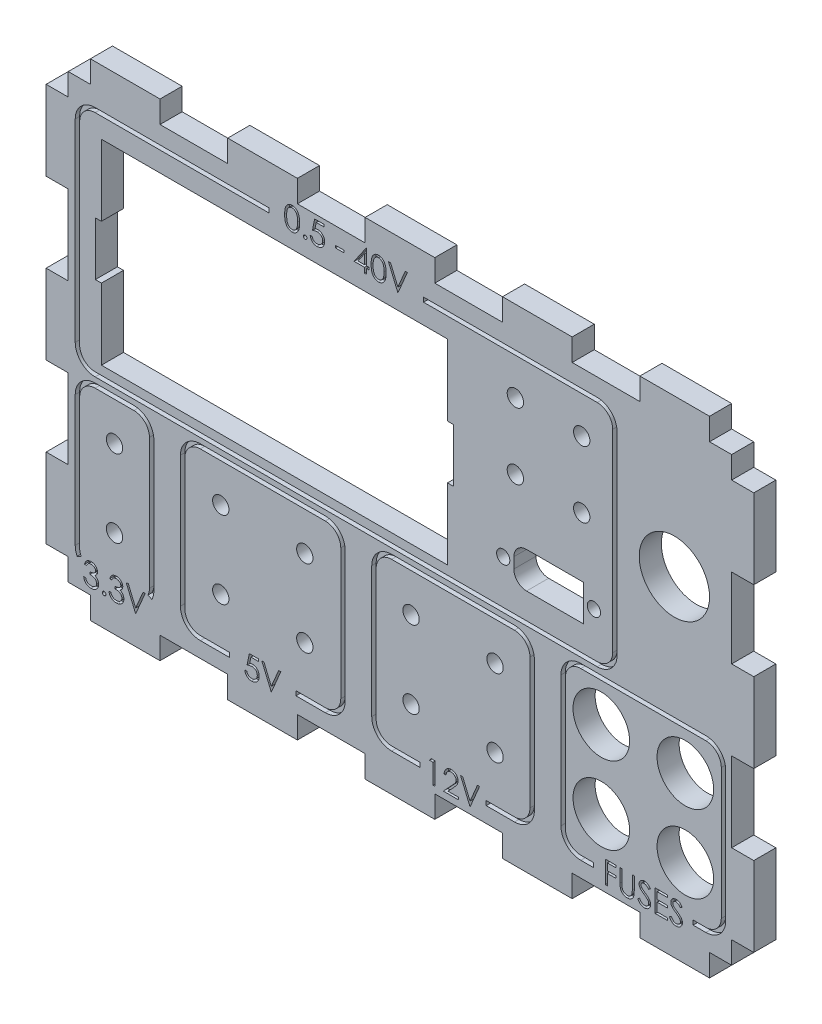
from build123d import *

# Parameters (mm, degrees)
BOSS_EXTRUDE1_DEPTH     = 5
SKETCH2_R               = 1.85
SKETCH2_R_2             = 1.5
SKETCH2_R_3             = 6.4
CUT_EXTRUDE1_DEPTH      = 5
CUT_EXTRUDE_THIN1_DEPTH = 1
SKETCH4_W               = 1.923076923
SKETCH4_H               = 0.512820512
CUT_EXTRUDE2_DEPTH      = 1
SKETCH5_R               = 7.95
CUT_EXTRUDE3_DEPTH      = 98.211110615


with BuildPart() as part:
    # Sketch1 → Boss-Extrude1 (new body)
    with BuildSketch(Plane.XY):
        Polygon((-70, 50), (-75, 50), (-75, 45), (-80, 45), (-80, 27), (-75, 27), (-75, 9), (-80, 9), (-80, -9), (-75, -9), (-75, -27), (-80, -27), (-80, -45), (-75, -45), (-75, -50), (-70, -50), (-70, -55), (-54.25, -55), (-54.25, -50), (-38.9375, -50), (-38.9375, -55), (-23.1875, -55), (-23.1875, -50), (-7.875, -50), (-7.875, -55), (7.875, -55), (7.875, -50), (23.1875, -50), (23.1875, -55), (38.9375, -55), (38.9375, -50), (54.25, -50), (54.25, -55), (70, -55), (70, -50), (75, -50), (75, -45), (80, -45), (80, -27), (75, -27), (75, -9), (80, -9), (80, 9), (75, 9), (75, 27), (80, 27), (80, 45), (75, 45), (75, 50), (70, 50), (70, 55), (54.25, 55), (54.25, 50), (38.9375, 50), (38.9375, 55), (23.1875, 55), (23.1875, 50), (7.875, 50), (7.875, 55), (-7.875, 55), (-7.875, 50), (-23.1875, 50), (-23.1875, 55), (-38.9375, 55), (-38.9375, 50), (-54.25, 50), (-54.25, 55), (-70, 55), align=None)
    extrude(amount=BOSS_EXTRUDE1_DEPTH)

    # Sketch2 → Cut-Extrude1 (cut)
    with BuildSketch(Plane.XY.offset(5)):
        with Locations((-64.53, -17.625)):
            Circle(SKETCH2_R)
        with Locations((-40.51, -17.625)):
            Circle(SKETCH2_R)
        with Locations((2.51, -17.625)):
            Circle(SKETCH2_R)
        with Locations((-64.53, -35.125)):
            Circle(SKETCH2_R)
        with Locations((-21.51, -17.625)):
            Circle(SKETCH2_R)
        with Locations((-21.51, -35.125)):
            Circle(SKETCH2_R)
        with Locations((-40.51, -35.125)):
            Circle(SKETCH2_R)
        with Locations((21.51, -17.625)):
            Circle(SKETCH2_R)
        with Locations((21.51, -35.125)):
            Circle(SKETCH2_R)
        with Locations((2.51, -35.125)):
            Circle(SKETCH2_R)
        with Locations((26.1, 36.6625)):
            Circle(SKETCH2_R)
        with Locations((41.1, 36.6625)):
            Circle(SKETCH2_R)
        with Locations((41.1, 21.6625)):
            Circle(SKETCH2_R)
        with Locations((26.1, 21.6625)):
            Circle(SKETCH2_R)
        with Locations((23.35, 4.1625)):
            Circle(SKETCH2_R_2)
        with Locations((43.85, 4.1625)):
            Circle(SKETCH2_R_2)
        with Locations((45.53, -17.625)):
            Circle(SKETCH2_R_3)
        with Locations((64.53, -17.625)):
            Circle(SKETCH2_R_3)
        with Locations((64.53, -35.125)):
            Circle(SKETCH2_R_3)
        with Locations((45.53, -35.125)):
            Circle(SKETCH2_R_3)
        Polygon((-67.5, 40.5), (10.75, 40.5), (10.75, 24.425), (12.125, 24.425), (12.125, 12.325), (10.75, 12.325), (10.75, -3.75), (-67.5, -3.75), (-67.5, 12.325), (-68.875, 12.325), (-68.875, 24.425), (-67.5, 24.425), align=None)
        with BuildLine():
            Line((28.62, 8.2375), (41.45, 8.2375))
            Line((41.45, 8.2375), (41.45, 0.0875))
            Line((41.45, 0.0875), (28.62, 0.0875))
            ThreePointArc((28.62, 0.0875), (26.590603538, 0.928103538), (25.75, 2.9575))
            Line((25.75, 2.9575), (25.75, 5.3675))
            ThreePointArc((25.75, 5.3675), (26.590603538, 7.396896462), (28.62, 8.2375))
        make_face()
    extrude(amount=-CUT_EXTRUDE1_DEPTH, mode=Mode.SUBTRACT)

    # Sketch3 → Cut-Extrude-Thin1 (cut)
    with BuildSketch(Plane.XY.offset(5)):
        with BuildLine():
            Line((5.34, 45), (44.6, 45))
            ThreePointArc((44.6, 45), (47.074873734, 43.974873734), (48.1, 41.5))
            Line((48.1, 41.5), (48.1, -2.25))
            ThreePointArc((48.1, -2.25), (47.074873734, -4.724873734), (44.6, -5.75))
            Line((44.6, -5.75), (-68.92, -5.75))
            ThreePointArc((-68.92, -5.75), (-71.394873734, -4.724873734), (-72.42, -2.25))
            Line((-72.42, -2.25), (-72.42, 41.5))
            ThreePointArc((-72.42, 41.5), (-71.394873734, 43.974873734), (-68.92, 45))
            Line((-68.92, 45), (-29.66, 45))
            Line((-29.66, 45), (-29.66, 46))
            Line((-29.66, 46), (-68.92, 46))
            ThreePointArc((-68.92, 46), (-72.101980515, 44.681980515), (-73.42, 41.5))
            Line((-73.42, 41.5), (-73.42, -2.25))
            ThreePointArc((-73.42, -2.25), (-72.101980515, -5.431980515), (-68.92, -6.75))
            Line((-68.92, -6.75), (44.6, -6.75))
            ThreePointArc((44.6, -6.75), (47.781980515, -5.431980515), (49.1, -2.25))
            Line((49.1, -2.25), (49.1, 41.5))
            ThreePointArc((49.1, 41.5), (47.781980515, 44.681980515), (44.6, 46))
            Line((44.6, 46), (5.34, 46))
            Line((5.34, 46), (5.34, 45))
        make_face()
        with BuildLine():
            ThreePointArc((-72.07875, -43.507414488), (-72.333621611, -42.772779076), (-72.42, -42))
            Line((-72.42, -42), (-72.42, -12.455))
            ThreePointArc((-72.42, -12.455), (-71.394873734, -9.980126266), (-68.92, -8.955))
            Line((-68.92, -8.955), (-60.14, -8.955))
            ThreePointArc((-60.14, -8.955), (-57.665126266, -9.980126266), (-56.64, -12.455))
            Line((-56.64, -12.455), (-56.64, -42))
            ThreePointArc((-56.64, -42), (-56.726378389, -42.772779076), (-56.98125, -43.507414488))
            Line((-56.98125, -43.507414488), (-56.07875, -43.938104341))
            ThreePointArc((-56.07875, -43.938104341), (-55.751057929, -42.993573097), (-55.64, -42))
            Line((-55.64, -42), (-55.64, -12.455))
            ThreePointArc((-55.64, -12.455), (-56.958019485, -9.273019485), (-60.14, -7.955))
            Line((-60.14, -7.955), (-68.92, -7.955))
            ThreePointArc((-68.92, -7.955), (-72.101980515, -9.273019485), (-73.42, -12.455))
            Line((-73.42, -12.455), (-73.42, -42))
            ThreePointArc((-73.42, -42), (-73.308942071, -42.993573097), (-72.98125, -43.938104341))
            Line((-72.98125, -43.938104341), (-72.07875, -43.507414488))
        make_face()
        with BuildLine():
            Line((-38.51, -45.5), (-45.14, -45.5))
            ThreePointArc((-45.14, -45.5), (-47.614873734, -44.474873734), (-48.64, -42))
            Line((-48.64, -42), (-48.64, -12.455))
            ThreePointArc((-48.64, -12.455), (-47.614873734, -9.980126266), (-45.14, -8.955))
            Line((-45.14, -8.955), (-16.88, -8.955))
            ThreePointArc((-16.88, -8.955), (-14.405126266, -9.980126266), (-13.38, -12.455))
            Line((-13.38, -12.455), (-13.38, -42))
            ThreePointArc((-13.38, -42), (-14.405126266, -44.474873734), (-16.88, -45.5))
            Line((-16.88, -45.5), (-23.51, -45.5))
            Line((-23.51, -45.5), (-23.51, -46.5))
            Line((-23.51, -46.5), (-16.88, -46.5))
            ThreePointArc((-16.88, -46.5), (-13.698019485, -45.181980515), (-12.38, -42))
            Line((-12.38, -42), (-12.38, -12.455))
            ThreePointArc((-12.38, -12.455), (-13.698019485, -9.273019485), (-16.88, -7.955))
            Line((-16.88, -7.955), (-45.14, -7.955))
            ThreePointArc((-45.14, -7.955), (-48.321980515, -9.273019485), (-49.64, -12.455))
            Line((-49.64, -12.455), (-49.64, -42))
            ThreePointArc((-49.64, -42), (-48.321980515, -45.181980515), (-45.14, -46.5))
            Line((-45.14, -46.5), (-38.51, -46.5))
            Line((-38.51, -46.5), (-38.51, -45.5))
        make_face()
        with BuildLine():
            Line((4.51, -45.5), (-1.88, -45.5))
            ThreePointArc((-1.88, -45.5), (-4.354873734, -44.474873734), (-5.38, -42))
            Line((-5.38, -42), (-5.38, -12.455))
            ThreePointArc((-5.38, -12.455), (-4.354873734, -9.980126266), (-1.88, -8.955))
            Line((-1.88, -8.955), (25.9, -8.955))
            ThreePointArc((25.9, -8.955), (28.374873734, -9.980126266), (29.4, -12.455))
            Line((29.4, -12.455), (29.4, -42))
            ThreePointArc((29.4, -42), (28.374873734, -44.474873734), (25.9, -45.5))
            Line((25.9, -45.5), (19.51, -45.5))
            Line((19.51, -45.5), (19.51, -46.5))
            Line((19.51, -46.5), (25.9, -46.5))
            ThreePointArc((25.9, -46.5), (29.081980515, -45.181980515), (30.4, -42))
            Line((30.4, -42), (30.4, -12.455))
            ThreePointArc((30.4, -12.455), (29.081980515, -9.273019485), (25.9, -7.955))
            Line((25.9, -7.955), (-1.88, -7.955))
            ThreePointArc((-1.88, -7.955), (-5.061980515, -9.273019485), (-6.38, -12.455))
            Line((-6.38, -12.455), (-6.38, -42))
            ThreePointArc((-6.38, -42), (-5.061980515, -45.181980515), (-1.88, -46.5))
            Line((-1.88, -46.5), (4.51, -46.5))
            Line((4.51, -46.5), (4.51, -45.5))
        make_face()
        with BuildLine():
            Line((43.78, -45.5), (40.9, -45.5))
            ThreePointArc((40.9, -45.5), (38.425126266, -44.474873734), (37.4, -42))
            Line((37.4, -42), (37.4, -12.455))
            ThreePointArc((37.4, -12.455), (38.425126266, -9.980126266), (40.9, -8.955))
            Line((40.9, -8.955), (69.16, -8.955))
            ThreePointArc((69.16, -8.955), (71.634873734, -9.980126266), (72.66, -12.455))
            Line((72.66, -12.455), (72.66, -42))
            ThreePointArc((72.66, -42), (71.634873734, -44.474873734), (69.16, -45.5))
            Line((69.16, -45.5), (66.28, -45.5))
            Line((66.28, -45.5), (66.28, -46.5))
            Line((66.28, -46.5), (69.16, -46.5))
            ThreePointArc((69.16, -46.5), (72.341980515, -45.181980515), (73.66, -42))
            Line((73.66, -42), (73.66, -12.455))
            ThreePointArc((73.66, -12.455), (72.341980515, -9.273019485), (69.16, -7.955))
            Line((69.16, -7.955), (40.9, -7.955))
            ThreePointArc((40.9, -7.955), (37.718019485, -9.273019485), (36.4, -12.455))
            Line((36.4, -12.455), (36.4, -42))
            ThreePointArc((36.4, -42), (37.718019485, -45.181980515), (40.9, -46.5))
            Line((40.9, -46.5), (43.78, -46.5))
            Line((43.78, -46.5), (43.78, -45.5))
        make_face()
    extrude(amount=-CUT_EXTRUDE_THIN1_DEPTH, mode=Mode.SUBTRACT)

    # Sketch4 → Cut-Extrude2 (cut)
    # profile 1 of 21: a face of its own
    with BuildSketch(Plane.XY.offset(5)):
        with BuildLine():
            Line((-70.876153846, -44.653846154), (-71.324871795, -44.653846154))
            add(Edge.make_bspline(
                [(-71.324871795, -44.653846154), (-71.312715294, -44.603514034), (-71.288950329, -44.505118856), (-71.239382367, -44.364537055), (-71.185383431, -44.231503453), (-71.120541853, -44.108509062), (-71.049815061, -43.993082058), (-70.968782602, -43.887840452), (-70.881182998, -43.790107644), (-70.784290213, -43.703374447), (-70.68267784, -43.624834834), (-70.574914097, -43.557870467), (-70.463167106, -43.500264534), (-70.34666263, -43.45280706), (-70.225053814, -43.417056312), (-70.099440066, -43.391118018), (-69.969492209, -43.374273569), (-69.881281365, -43.372629622), (-69.836490385, -43.371794872)],
                knots=[0, 0, 0, 0, 1.162005537, 2.271625781, 3.343758855, 4.383309926, 5.390229558, 6.379919256, 7.361854164, 8.333198761, 9.295911338, 10.242430842, 11.177959212, 12.116337295, 13.062827104, 14.020064771, 14.994644689, 16, 16, 16, 16], degree=3))
            add(Edge.make_bspline(
                [(-69.836490385, -43.371794872), (-69.771229325, -43.373765201), (-69.642130737, -43.37766288), (-69.452469242, -43.413254932), (-69.269573786, -43.46957655), (-69.095446289, -43.54739616), (-68.933705671, -43.643378036), (-68.789796833, -43.757613374), (-68.665670389, -43.887898091), (-68.561535564, -44.031801754), (-68.479999851, -44.185595339), (-68.41987646, -44.343881278), (-68.383274059, -44.506284094), (-68.378530406, -44.61593735), (-68.376153846, -44.670873397)],
                knots=[0, 0, 0, 0, 1.083050992, 2.142477498, 3.193116406, 4.255571735, 5.30263384, 6.308962982, 7.297363603, 8.282367274, 9.249857812, 10.179914175, 11.08814088, 12, 12, 12, 12], degree=3))
            add(Edge.make_bspline(
                [(-68.376153846, -44.670873397), (-68.377816119, -44.723740247), (-68.381068929, -44.827192468), (-68.408688509, -44.978223178), (-68.455168884, -45.120568321), (-68.519554259, -45.254827124), (-68.602899331, -45.380148324), (-68.703860327, -45.496813882), (-68.823149843, -45.605341251), (-68.913548326, -45.667511927), (-68.960088141, -45.699519231)],
                knots=[0, 0, 0, 0, 1.024540389, 2.004866551, 2.965041327, 3.920577974, 4.882998113, 5.874504559, 6.905732034, 8, 8, 8, 8], degree=3))
            add(Edge.make_bspline(
                [(-68.960088141, -45.699519231), (-68.90689992, -45.725202333), (-68.801518671, -45.776087987), (-68.657875058, -45.875881926), (-68.527478093, -45.991105279), (-68.454758494, -46.081023355), (-68.418221154, -46.126201923)],
                knots=[0, 0, 0, 0, 1.015518401, 2.012035669, 3.001164323, 4, 4, 4, 4], degree=3))
            add(Edge.make_bspline(
                [(-68.418221154, -46.126201923), (-68.394162093, -46.159141568), (-68.346437956, -46.224481449), (-68.287530051, -46.329533486), (-68.234088459, -46.435749899), (-68.192445288, -46.545977622), (-68.160196907, -46.65893907), (-68.137145433, -46.774828208), (-68.122825231, -46.893739668), (-68.120774443, -46.974186068), (-68.11974359, -47.014623397)],
                knots=[0, 0, 0, 0, 1.025084078, 2.033381695, 3.024893161, 4.013698104, 4.991890475, 5.976764909, 6.982997093, 8, 8, 8, 8], degree=3))
            add(Edge.make_bspline(
                [(-68.11974359, -47.014623397), (-68.12230718, -47.084637285), (-68.127422298, -47.224335573), (-68.173142404, -47.430728033), (-68.244018462, -47.63247875), (-68.344671228, -47.825442806), (-68.467339097, -48.005986208), (-68.613278132, -48.167523792), (-68.780830144, -48.306378941), (-68.967695357, -48.422393553), (-69.170148397, -48.515133441), (-69.386684957, -48.579501217), (-69.614185034, -48.621424074), (-69.770195459, -48.625919601), (-69.849511218, -48.628205128)],
                knots=[0, 0, 0, 0, 0.955779014, 1.907060117, 2.875433937, 3.871313158, 4.872415639, 5.851225146, 6.836215519, 7.83643374, 8.849228613, 9.86973379, 10.916971861, 12, 12, 12, 12], degree=3))
            add(Edge.make_bspline(
                [(-69.849511218, -48.628205128), (-69.902967361, -48.626964824), (-70.008151226, -48.624524318), (-70.162784795, -48.607840602), (-70.310387222, -48.577369166), (-70.451158076, -48.536364444), (-70.585222414, -48.484376241), (-70.712171136, -48.419635243), (-70.832785269, -48.343475955), (-70.945926628, -48.254999401), (-71.051581725, -48.156026058), (-71.14694276, -48.044798901), (-71.233599607, -47.923374038), (-71.309231948, -47.790341101), (-71.377284737, -47.647419305), (-71.433257532, -47.492778593), (-71.48252263, -47.327801419), (-71.505427579, -47.212833218), (-71.517179487, -47.153846154)],
                knots=[0, 0, 0, 0, 1.048658725, 2.063410685, 3.046034179, 4.001477787, 4.936774919, 5.862367409, 6.792675028, 7.730719943, 8.675894397, 9.627829632, 10.600096036, 11.597688215, 12.626045268, 13.701542398, 14.82072376, 16, 16, 16, 16], degree=3))
            Line((-71.517179487, -47.153846154), (-71.068461538, -47.153846154))
            add(Edge.make_bspline(
                [(-71.068461538, -47.153846154), (-71.056771122, -47.192344744), (-71.034032247, -47.267227847), (-70.995326107, -47.374999712), (-70.951228575, -47.473796931), (-70.903922063, -47.564344248), (-70.854238569, -47.647533394), (-70.798645818, -47.721164636), (-70.741261325, -47.788472067), (-70.698005106, -47.826392942), (-70.676834936, -47.844951923)],
                knots=[0, 0, 0, 0, 1.198163088, 2.33053128, 3.407730985, 4.417276592, 5.372219308, 6.28897303, 7.162600585, 8, 8, 8, 8], degree=3))
            add(Edge.make_bspline(
                [(-70.676834936, -47.844951923), (-70.648839827, -47.866535257), (-70.592936022, -47.909635303), (-70.501838549, -47.964637629), (-70.406031569, -48.012296237), (-70.303439178, -48.048701516), (-70.19627522, -48.079526746), (-70.082807555, -48.099698916), (-69.964037245, -48.113539161), (-69.88294044, -48.114760492), (-69.841498397, -48.115384615)],
                knots=[0, 0, 0, 0, 0.946170439, 1.889420265, 2.845303464, 3.807233317, 4.801018734, 5.828864929, 6.890507805, 8, 8, 8, 8], degree=3))
            add(Edge.make_bspline(
                [(-69.841498397, -48.115384615), (-69.794707679, -48.114504751), (-69.703212469, -48.112784251), (-69.569705528, -48.096961813), (-69.442694888, -48.073918365), (-69.323590709, -48.03832839), (-69.210832841, -47.994355745), (-69.106001913, -47.939143737), (-69.007721761, -47.874365563), (-68.917251182, -47.800738194), (-68.835900457, -47.720136058), (-68.764272581, -47.635831671), (-68.703380207, -47.548180486), (-68.65426081, -47.456697456), (-68.61547431, -47.361761415), (-68.589069737, -47.263105944), (-68.57071043, -47.161538421), (-68.56921527, -47.092497037), (-68.568461538, -47.057692308)],
                knots=[0, 0, 0, 0, 1.217147791, 2.380027433, 3.494444702, 4.572153297, 5.609568379, 6.639424714, 7.649109417, 8.668170816, 9.669597737, 10.625200337, 11.543417969, 12.441394052, 13.322311151, 14.205496177, 15.095365482, 16, 16, 16, 16], degree=3))
            add(Edge.make_bspline(
                [(-68.568461538, -47.057692308), (-68.570647683, -47.011104681), (-68.575009096, -46.91816124), (-68.608307066, -46.781421849), (-68.663076872, -46.649674116), (-68.739751888, -46.525165845), (-68.833088644, -46.4097717), (-68.942181368, -46.306812439), (-69.06793598, -46.221855166), (-69.18367865, -46.163157086), (-69.286200302, -46.123104121), (-69.373936565, -46.096425601), (-69.472160284, -46.073834664), (-69.57968364, -46.052817133), (-69.697316806, -46.034929493), (-69.824931718, -46.020012613), (-69.962554234, -46.00807684), (-70.057827328, -46.002746704), (-70.106923077, -46)],
                knots=[0, 0, 0, 0, 1.07054697, 2.135767047, 3.216561865, 4.33974944, 5.486079747, 6.621378074, 7.775625952, 8.963672916, 9.598146892, 10.304877434, 11.070270905, 11.915000392, 12.823868403, 13.805723172, 14.86925407, 16, 16, 16, 16], degree=3))
            Line((-70.106923077, -46), (-70.106923077, -45.487179487))
            add(Edge.make_bspline(
                [(-70.106923077, -45.487179487), (-70.045064269, -45.486129768), (-69.923898059, -45.484073625), (-69.746906195, -45.459205038), (-69.577658607, -45.424804141), (-69.419906118, -45.372111009), (-69.276122242, -45.310910585), (-69.151379953, -45.239693143), (-69.047426886, -45.160529216), (-68.964768212, -45.072196917), (-68.9025836, -44.977461135), (-68.857116746, -44.878723052), (-68.830259137, -44.775117251), (-68.826673899, -44.704410582), (-68.824871795, -44.668870192)],
                knots=[0, 0, 0, 0, 1.321986639, 2.589447074, 3.816329219, 5.01088745, 6.139805852, 7.153945165, 8.075214402, 8.924034688, 9.728124013, 10.488707548, 11.240355623, 12, 12, 12, 12], degree=3))
            add(Edge.make_bspline(
                [(-68.824871795, -44.668870192), (-68.825463811, -44.642759128), (-68.826641598, -44.590812403), (-68.841494852, -44.514919448), (-68.86381491, -44.441346668), (-68.894500238, -44.370406939), (-68.93557195, -44.302592262), (-68.984723359, -44.237324478), (-69.043249217, -44.174976222), (-69.110314141, -44.11686148), (-69.182331006, -44.061476856), (-69.261259256, -44.014457374), (-69.344719077, -43.974250143), (-69.432802869, -43.941093711), (-69.525796484, -43.916151871), (-69.623262995, -43.898243526), (-69.725388257, -43.887046876), (-69.79506216, -43.885434854), (-69.830480769, -43.884615385)],
                knots=[0, 0, 0, 0, 0.884392785, 1.759457502, 2.611959086, 3.489218968, 4.37281399, 5.2945488, 6.255912374, 7.266815255, 8.301784654, 9.332968512, 10.37626691, 11.440494194, 12.520033166, 13.637162961, 14.798855837, 16, 16, 16, 16], degree=3))
            add(Edge.make_bspline(
                [(-69.830480769, -43.884615385), (-69.887411724, -43.886603045), (-69.998611118, -43.890485407), (-70.158918143, -43.924489712), (-70.307945763, -43.978744117), (-70.421858143, -44.043505573), (-70.505976106, -44.107434764), (-70.566086018, -44.163266745), (-70.625115319, -44.225313636), (-70.679180571, -44.297397029), (-70.733857681, -44.374635301), (-70.783635626, -44.460954846), (-70.832006615, -44.554103981), (-70.861153114, -44.619954887), (-70.876153846, -44.653846154)],
                knots=[0, 0, 0, 0, 1.472543308, 2.876219568, 4.221790263, 5.565193594, 6.249813518, 6.953379497, 7.687249741, 8.463570142, 9.283606569, 10.136032583, 11.040678096, 12, 12, 12, 12], degree=3))
        make_face()
    # profile 2 of 21: a face of its own
    with BuildSketch(Plane.XY.offset(5)):
        with BuildLine():
            add(Edge.make_bspline(
                [(-66.86974359, -47.730769231), (-66.841900429, -47.732423755), (-66.787317169, -47.735667255), (-66.708404128, -47.757919646), (-66.636983186, -47.797432018), (-66.573365693, -47.85009313), (-66.52092787, -47.913944078), (-66.480007367, -47.984795376), (-66.457948817, -48.06436908), (-66.454728943, -48.119268615), (-66.453076923, -48.147435897)],
                knots=[0, 0, 0, 0, 1.020151414, 1.999887582, 2.974338812, 3.990962822, 5.007586832, 5.987933904, 6.967670073, 8, 8, 8, 8], degree=3))
            add(Edge.make_bspline(
                [(-66.453076923, -48.147435897), (-66.454784924, -48.174926369), (-66.458153077, -48.229137174), (-66.479956803, -48.308110692), (-66.521239732, -48.37900627), (-66.573004008, -48.44372361), (-66.636998913, -48.496496282), (-66.708572979, -48.535672489), (-66.787131919, -48.559518174), (-66.841869524, -48.562555742), (-66.86974359, -48.564102564)],
                knots=[0, 0, 0, 0, 1.009421747, 1.99056486, 2.972319754, 3.999869655, 5.017953583, 5.993804169, 6.978383603, 8, 8, 8, 8], degree=3))
            add(Edge.make_bspline(
                [(-66.86974359, -48.564102564), (-66.897637741, -48.562611711), (-66.95209443, -48.559701175), (-67.030360136, -48.535182881), (-67.102370091, -48.496863652), (-67.166352537, -48.443625209), (-67.218550353, -48.37933929), (-67.258015186, -48.307622438), (-67.281715399, -48.229363242), (-67.28483236, -48.174970895), (-67.286410256, -48.147435897)],
                knots=[0, 0, 0, 0, 1.022052826, 1.995314843, 2.982371812, 4.00089066, 5.028879526, 6.005146991, 6.990147033, 8, 8, 8, 8], degree=3))
            add(Edge.make_bspline(
                [(-67.286410256, -48.147435897), (-67.284892972, -48.119222498), (-67.28193066, -48.064139298), (-67.257965431, -47.98528343), (-67.218856557, -47.913614231), (-67.165991707, -47.850190545), (-67.10238557, -47.797065827), (-67.030533848, -47.758401837), (-66.951905933, -47.735486962), (-66.897606021, -47.732369081), (-66.86974359, -47.730769231)],
                knots=[0, 0, 0, 0, 1.032775665, 2.016367738, 2.991239715, 4.008302682, 5.025365648, 6.011011707, 6.979408107, 8, 8, 8, 8], degree=3))
        make_face()
    # profile 3 of 21: a face of its own
    with BuildSketch(Plane.XY.offset(5)):
        with BuildLine():
            Line((-65.171025641, -44.653846154), (-65.61974359, -44.653846154))
            add(Edge.make_bspline(
                [(-65.61974359, -44.653846154), (-65.607587089, -44.603514034), (-65.583822124, -44.505118856), (-65.534254162, -44.364537055), (-65.480255226, -44.231503453), (-65.415413648, -44.108509062), (-65.344686856, -43.993082058), (-65.263654397, -43.887840452), (-65.176054793, -43.790107644), (-65.079162008, -43.703374447), (-64.977549634, -43.624834834), (-64.869785892, -43.557870467), (-64.758038901, -43.500264534), (-64.641534425, -43.45280706), (-64.519925609, -43.417056312), (-64.394311861, -43.391118018), (-64.264364004, -43.374273569), (-64.17615316, -43.372629622), (-64.131362179, -43.371794872)],
                knots=[0, 0, 0, 0, 1.162005537, 2.271625781, 3.343758855, 4.383309926, 5.390229558, 6.379919256, 7.361854164, 8.333198761, 9.295911338, 10.242430842, 11.177959212, 12.116337295, 13.062827104, 14.020064771, 14.994644689, 16, 16, 16, 16], degree=3))
            add(Edge.make_bspline(
                [(-64.131362179, -43.371794872), (-64.066101119, -43.373765201), (-63.937002532, -43.37766288), (-63.747341037, -43.413254932), (-63.564445581, -43.46957655), (-63.390318084, -43.54739616), (-63.228577466, -43.643378036), (-63.084668628, -43.757613374), (-62.960542184, -43.887898091), (-62.856407358, -44.031801754), (-62.774871646, -44.185595339), (-62.714748255, -44.343881278), (-62.678145853, -44.506284094), (-62.673402201, -44.61593735), (-62.671025641, -44.670873397)],
                knots=[0, 0, 0, 0, 1.083050992, 2.142477498, 3.193116406, 4.255571735, 5.30263384, 6.308962982, 7.297363603, 8.282367274, 9.249857812, 10.179914175, 11.08814088, 12, 12, 12, 12], degree=3))
            add(Edge.make_bspline(
                [(-62.671025641, -44.670873397), (-62.672687914, -44.723740247), (-62.675940724, -44.827192468), (-62.703560303, -44.978223178), (-62.750040679, -45.120568321), (-62.814426054, -45.254827124), (-62.897771126, -45.380148324), (-62.998732121, -45.496813882), (-63.118021638, -45.605341251), (-63.208420121, -45.667511927), (-63.254959936, -45.699519231)],
                knots=[0, 0, 0, 0, 1.024540389, 2.004866551, 2.965041327, 3.920577974, 4.882998113, 5.874504559, 6.905732034, 8, 8, 8, 8], degree=3))
            add(Edge.make_bspline(
                [(-63.254959936, -45.699519231), (-63.201771715, -45.725202333), (-63.096390466, -45.776087987), (-62.952746853, -45.875881926), (-62.822349888, -45.991105279), (-62.749630289, -46.081023355), (-62.713092949, -46.126201923)],
                knots=[0, 0, 0, 0, 1.015518401, 2.012035669, 3.001164323, 4, 4, 4, 4], degree=3))
            add(Edge.make_bspline(
                [(-62.713092949, -46.126201923), (-62.689033888, -46.159141568), (-62.641309751, -46.224481449), (-62.582401846, -46.329533486), (-62.528960254, -46.435749899), (-62.487317083, -46.545977622), (-62.455068702, -46.65893907), (-62.432017227, -46.774828208), (-62.417697026, -46.893739668), (-62.415646238, -46.974186068), (-62.414615385, -47.014623397)],
                knots=[0, 0, 0, 0, 1.025084078, 2.033381695, 3.024893161, 4.013698104, 4.991890475, 5.976764909, 6.982997093, 8, 8, 8, 8], degree=3))
            add(Edge.make_bspline(
                [(-62.414615385, -47.014623397), (-62.417178975, -47.084637285), (-62.422294093, -47.224335573), (-62.468014199, -47.430728033), (-62.538890257, -47.63247875), (-62.639543022, -47.825442806), (-62.762210892, -48.005986208), (-62.908149927, -48.167523792), (-63.075701939, -48.306378941), (-63.262567151, -48.422393553), (-63.465020192, -48.515133441), (-63.681556752, -48.579501217), (-63.909056829, -48.621424074), (-64.065067254, -48.625919601), (-64.144383013, -48.628205128)],
                knots=[0, 0, 0, 0, 0.955779014, 1.907060117, 2.875433937, 3.871313158, 4.872415639, 5.851225146, 6.836215519, 7.83643374, 8.849228613, 9.86973379, 10.916971861, 12, 12, 12, 12], degree=3))
            add(Edge.make_bspline(
                [(-64.144383013, -48.628205128), (-64.197839156, -48.626964824), (-64.30302302, -48.624524318), (-64.45765659, -48.607840602), (-64.605259017, -48.577369166), (-64.746029871, -48.536364444), (-64.880094209, -48.484376241), (-65.007042931, -48.419635243), (-65.127657064, -48.343475955), (-65.240798423, -48.254999401), (-65.34645352, -48.156026058), (-65.441814554, -48.044798901), (-65.528471401, -47.923374038), (-65.604103743, -47.790341101), (-65.672156532, -47.647419305), (-65.728129327, -47.492778593), (-65.777394425, -47.327801419), (-65.800299374, -47.212833218), (-65.812051282, -47.153846154)],
                knots=[0, 0, 0, 0, 1.048658725, 2.063410685, 3.046034179, 4.001477787, 4.936774919, 5.862367409, 6.792675028, 7.730719943, 8.675894397, 9.627829632, 10.600096036, 11.597688215, 12.626045268, 13.701542398, 14.82072376, 16, 16, 16, 16], degree=3))
            Line((-65.812051282, -47.153846154), (-65.363333333, -47.153846154))
            add(Edge.make_bspline(
                [(-65.363333333, -47.153846154), (-65.351642917, -47.192344744), (-65.328904042, -47.267227847), (-65.290197902, -47.374999712), (-65.24610037, -47.473796931), (-65.198793858, -47.564344248), (-65.149110364, -47.647533394), (-65.093517613, -47.721164636), (-65.03613312, -47.788472067), (-64.992876901, -47.826392942), (-64.971706731, -47.844951923)],
                knots=[0, 0, 0, 0, 1.198163088, 2.33053128, 3.407730985, 4.417276592, 5.372219308, 6.28897303, 7.162600585, 8, 8, 8, 8], degree=3))
            add(Edge.make_bspline(
                [(-64.971706731, -47.844951923), (-64.943711621, -47.866535257), (-64.887807817, -47.909635303), (-64.796710344, -47.964637629), (-64.700903364, -48.012296237), (-64.598310972, -48.048701516), (-64.491147015, -48.079526746), (-64.37767935, -48.099698916), (-64.25890904, -48.113539161), (-64.177812235, -48.114760492), (-64.136370192, -48.115384615)],
                knots=[0, 0, 0, 0, 0.946170439, 1.889420265, 2.845303464, 3.807233317, 4.801018734, 5.828864929, 6.890507805, 8, 8, 8, 8], degree=3))
            add(Edge.make_bspline(
                [(-64.136370192, -48.115384615), (-64.089579474, -48.114504751), (-63.998084264, -48.112784251), (-63.864577322, -48.096961813), (-63.737566683, -48.073918365), (-63.618462503, -48.03832839), (-63.505704636, -47.994355745), (-63.400873708, -47.939143737), (-63.302593556, -47.874365563), (-63.212122977, -47.800738194), (-63.130772252, -47.720136058), (-63.059144376, -47.635831671), (-62.998252002, -47.548180486), (-62.949132605, -47.456697456), (-62.910346104, -47.361761415), (-62.883941532, -47.263105944), (-62.865582225, -47.161538421), (-62.864087065, -47.092497037), (-62.863333333, -47.057692308)],
                knots=[0, 0, 0, 0, 1.217147791, 2.380027433, 3.494444702, 4.572153297, 5.609568379, 6.639424714, 7.649109417, 8.668170816, 9.669597737, 10.625200337, 11.543417969, 12.441394052, 13.322311151, 14.205496177, 15.095365482, 16, 16, 16, 16], degree=3))
            add(Edge.make_bspline(
                [(-62.863333333, -47.057692308), (-62.865519478, -47.011104681), (-62.86988089, -46.91816124), (-62.903178861, -46.781421849), (-62.957948667, -46.649674116), (-63.034623683, -46.525165845), (-63.127960438, -46.4097717), (-63.237053163, -46.306812439), (-63.362807775, -46.221855166), (-63.478550445, -46.163157086), (-63.581072097, -46.123104121), (-63.66880836, -46.096425601), (-63.767032079, -46.073834664), (-63.874555435, -46.052817133), (-63.992188601, -46.034929493), (-64.119803513, -46.020012613), (-64.257426029, -46.00807684), (-64.352699123, -46.002746704), (-64.401794872, -46)],
                knots=[0, 0, 0, 0, 1.07054697, 2.135767047, 3.216561865, 4.33974944, 5.486079747, 6.621378074, 7.775625952, 8.963672916, 9.598146892, 10.304877434, 11.070270905, 11.915000392, 12.823868403, 13.805723172, 14.86925407, 16, 16, 16, 16], degree=3))
            Line((-64.401794872, -46), (-64.401794872, -45.487179487))
            add(Edge.make_bspline(
                [(-64.401794872, -45.487179487), (-64.339936064, -45.486129768), (-64.218769854, -45.484073625), (-64.04177799, -45.459205038), (-63.872530402, -45.424804141), (-63.714777913, -45.372111009), (-63.570994037, -45.310910585), (-63.446251748, -45.239693143), (-63.342298681, -45.160529216), (-63.259640007, -45.072196917), (-63.197455395, -44.977461135), (-63.151988541, -44.878723052), (-63.125130932, -44.775117251), (-63.121545694, -44.704410582), (-63.11974359, -44.668870192)],
                knots=[0, 0, 0, 0, 1.321986639, 2.589447074, 3.816329219, 5.01088745, 6.139805852, 7.153945165, 8.075214402, 8.924034688, 9.728124013, 10.488707548, 11.240355623, 12, 12, 12, 12], degree=3))
            add(Edge.make_bspline(
                [(-63.11974359, -44.668870192), (-63.120335605, -44.642759128), (-63.121513392, -44.590812403), (-63.136366646, -44.514919448), (-63.158686705, -44.441346668), (-63.189372033, -44.370406939), (-63.230443745, -44.302592262), (-63.279595154, -44.237324478), (-63.338121012, -44.174976222), (-63.405185936, -44.11686148), (-63.4772028, -44.061476856), (-63.55613105, -44.014457374), (-63.639590872, -43.974250143), (-63.727674664, -43.941093711), (-63.820668279, -43.916151871), (-63.91813479, -43.898243526), (-64.020260052, -43.887046876), (-64.089933955, -43.885434854), (-64.125352564, -43.884615385)],
                knots=[0, 0, 0, 0, 0.884392785, 1.759457502, 2.611959086, 3.489218968, 4.37281399, 5.2945488, 6.255912374, 7.266815255, 8.301784654, 9.332968512, 10.37626691, 11.440494194, 12.520033166, 13.637162961, 14.798855837, 16, 16, 16, 16], degree=3))
            add(Edge.make_bspline(
                [(-64.125352564, -43.884615385), (-64.182283518, -43.886603045), (-64.293482913, -43.890485407), (-64.453789937, -43.924489712), (-64.602817557, -43.978744117), (-64.716729938, -44.043505573), (-64.800847901, -44.107434764), (-64.860957813, -44.163266745), (-64.919987114, -44.225313636), (-64.974052366, -44.297397029), (-65.028729476, -44.374635301), (-65.078507421, -44.460954846), (-65.12687841, -44.554103981), (-65.156024909, -44.619954887), (-65.171025641, -44.653846154)],
                knots=[0, 0, 0, 0, 1.472543308, 2.876219568, 4.221790263, 5.565193594, 6.249813518, 6.953379497, 7.687249741, 8.463570142, 9.283606569, 10.136032583, 11.040678096, 12, 12, 12, 12], degree=3))
        make_face()
    # profile 4 of 21: a face of its own
    with BuildSketch(Plane.XY.offset(5)):
        Polygon((-61.901794872, -43.5), (-61.421025641, -43.5), (-59.755360577, -47.437299679), (-58.08869391, -43.5), (-57.606923077, -43.5), (-59.722307692, -48.5), (-59.786410256, -48.5), align=None)
    # profile 5 of 21: a face of its own
    with BuildSketch(Plane.XY.offset(5)):
        with BuildLine():
            Line((-32.003589744, -43.5), (-32.003589744, -44.012820513))
            Line((-32.003589744, -44.012820513), (-33.703309295, -44.012820513))
            Line((-33.703309295, -44.012820513), (-33.973741987, -45.327924679))
            add(Edge.make_bspline(
                [(-33.973741987, -45.327924679), (-33.920805024, -45.313310005), (-33.81824803, -45.284996386), (-33.6668768, -45.253559571), (-33.523173652, -45.234608937), (-33.429923123, -45.23202135), (-33.384799679, -45.230769231)],
                knots=[0, 0, 0, 0, 1.100273476, 2.13160584, 3.095893838, 4, 4, 4, 4], degree=3))
            add(Edge.make_bspline(
                [(-33.384799679, -45.230769231), (-33.328965766, -45.23197771), (-33.219182341, -45.234353883), (-33.058555274, -45.257170811), (-32.905222569, -45.293084975), (-32.759504897, -45.343257149), (-32.621132682, -45.40741391), (-32.491379023, -45.487556682), (-32.36829629, -45.581175727), (-32.254092585, -45.688811458), (-32.15048643, -45.807270911), (-32.059392159, -45.934639298), (-31.98201703, -46.069678815), (-31.91978738, -46.213679685), (-31.870095474, -46.365049904), (-31.837021196, -46.525382165), (-31.814997326, -46.693165193), (-31.812536774, -46.807886008), (-31.811282051, -46.866386218)],
                knots=[0, 0, 0, 0, 1.052922333, 2.070308379, 3.05430497, 4.020497103, 4.973039431, 5.925935799, 6.892292201, 7.88610001, 8.88166317, 9.857072816, 10.836096531, 11.812156883, 12.81219415, 13.836441305, 14.89672472, 16, 16, 16, 16], degree=3))
            add(Edge.make_bspline(
                [(-31.811282051, -46.866386218), (-31.812232159, -46.907132247), (-31.814119534, -46.988073658), (-31.823717516, -47.108279659), (-31.842197111, -47.225940849), (-31.867008145, -47.341072837), (-31.899211599, -47.453457655), (-31.938195962, -47.56341698), (-31.985904573, -47.670266418), (-32.038235109, -47.775016983), (-32.097158649, -47.875300565), (-32.162556517, -47.969084831), (-32.231650076, -48.057776662), (-32.305994912, -48.140424852), (-32.386282048, -48.216486306), (-32.471539143, -48.286412422), (-32.561085885, -48.351385751), (-32.656307659, -48.408768887), (-32.755082635, -48.46157311), (-32.858837231, -48.504892449), (-32.96520966, -48.543621775), (-33.075730911, -48.574492529), (-33.190150643, -48.598681893), (-33.308657466, -48.615111322), (-33.430629851, -48.627077661), (-33.513308441, -48.627826743), (-33.555072115, -48.628205128)],
                knots=[0, 0, 0, 0, 1.056347294, 2.098418968, 3.122841568, 4.141288669, 5.149314143, 6.15115421, 7.162517403, 8.180376062, 9.185164535, 10.17417709, 11.141909838, 12.097768115, 13.052685741, 14.0056014, 14.954263652, 15.917497458, 16.885230207, 17.854509472, 18.828990115, 19.81800267, 20.826176721, 21.857883937, 22.917946725, 24, 24, 24, 24], degree=3))
            add(Edge.make_bspline(
                [(-33.555072115, -48.628205128), (-33.604892374, -48.627218217), (-33.702907846, -48.625276585), (-33.846508656, -48.604964463), (-33.984672378, -48.575873154), (-34.116286809, -48.532107054), (-34.242531471, -48.477268062), (-34.361706782, -48.407959246), (-34.476857891, -48.329417669), (-34.583303658, -48.23673145), (-34.682098106, -48.135423333), (-34.770535975, -48.025483846), (-34.849298228, -47.9087275), (-34.917123581, -47.78458728), (-34.974977897, -47.653389378), (-35.02042788, -47.514642234), (-35.057111244, -47.3690708), (-35.072630416, -47.2688515), (-35.080512821, -47.217948718)],
                knots=[0, 0, 0, 0, 1.0467383, 2.05933395, 3.04377827, 4.011590433, 4.970194871, 5.932262533, 6.905835911, 7.896367577, 8.894135286, 9.877477877, 10.858688626, 11.851381753, 12.8477658, 13.868841284, 14.917554742, 16, 16, 16, 16], degree=3))
            Line((-35.080512821, -47.217948718), (-34.631794872, -47.217948718))
            add(Edge.make_bspline(
                [(-34.631794872, -47.217948718), (-34.620754076, -47.265629364), (-34.599533052, -47.357274214), (-34.552953411, -47.486033273), (-34.49600216, -47.600775021), (-34.428281663, -47.703017283), (-34.347495905, -47.792172993), (-34.255311006, -47.871625939), (-34.151957116, -47.943304695), (-34.037109645, -48.003051506), (-33.915948103, -48.054006868), (-33.789137803, -48.08793786), (-33.660131594, -48.111796279), (-33.572876779, -48.114184508), (-33.529030449, -48.115384615)],
                knots=[0, 0, 0, 0, 1.136247022, 2.183929868, 3.172523383, 4.106158343, 5.02341133, 5.958108904, 6.928429099, 7.938127109, 8.96079061, 9.975095812, 10.982467395, 12, 12, 12, 12], degree=3))
            add(Edge.make_bspline(
                [(-33.529030449, -48.115384615), (-33.486232671, -48.114212076), (-33.401963496, -48.111903335), (-33.27794723, -48.094133318), (-33.158214552, -48.066765359), (-33.0439469, -48.025808423), (-32.9331447, -47.976030254), (-32.828610743, -47.912151574), (-32.727320918, -47.838637262), (-32.632423585, -47.754413505), (-32.545510086, -47.661599655), (-32.468715627, -47.562346236), (-32.404748608, -47.456465027), (-32.350842738, -47.345789094), (-32.309909454, -47.229105441), (-32.280708052, -47.106960905), (-32.263560825, -46.97905379), (-32.261201997, -46.891811919), (-32.26, -46.847355769)],
                knots=[0, 0, 0, 0, 1.027316725, 2.022795036, 3.002884548, 3.971462791, 4.93288096, 5.914575861, 6.907176829, 7.935150275, 8.956128384, 9.956726525, 10.942570165, 11.921478529, 12.907843606, 13.90538589, 14.932640048, 16, 16, 16, 16], degree=3))
            add(Edge.make_bspline(
                [(-32.26, -46.847355769), (-32.260940685, -46.807247553), (-32.262781942, -46.728741425), (-32.277825614, -46.613885416), (-32.303992717, -46.505209641), (-32.340312546, -46.402189307), (-32.386426128, -46.304727247), (-32.442778003, -46.212722875), (-32.510425714, -46.127388828), (-32.587699841, -46.04868518), (-32.672354185, -45.976049644), (-32.765845246, -45.914129521), (-32.86621657, -45.86203821), (-32.972258855, -45.817083926), (-33.086494424, -45.784797147), (-33.206661042, -45.760557311), (-33.334056339, -45.746535364), (-33.421157322, -45.744589809), (-33.465929487, -45.743589744)],
                knots=[0, 0, 0, 0, 1.045622112, 2.046656509, 3.013763289, 3.955457236, 4.890082067, 5.820317437, 6.762574623, 7.722996705, 8.69280354, 9.665887285, 10.63943826, 11.638615906, 12.663482002, 13.728887084, 14.832589034, 16, 16, 16, 16], degree=3))
            add(Edge.make_bspline(
                [(-33.465929487, -45.743589744), (-33.5046851, -45.74441916), (-33.584705607, -45.746131693), (-33.707452503, -45.758740974), (-33.836440678, -45.779082823), (-33.971175672, -45.807063177), (-34.112062112, -45.843679001), (-34.258802685, -45.887556859), (-34.411705923, -45.940016857), (-34.514731243, -45.979634305), (-34.567692308, -46)],
                knots=[0, 0, 0, 0, 0.817624296, 1.688186739, 2.600797293, 3.572016777, 4.590301741, 5.671205678, 6.80286297, 8, 8, 8, 8], degree=3))
            Line((-34.567692308, -46), (-34.054871795, -43.5))
            Line((-34.054871795, -43.5), (-32.003589744, -43.5))
        make_face()
    # profile 6 of 21: a face of its own
    with BuildSketch(Plane.XY.offset(5)):
        Polygon((-31.234358974, -43.5), (-30.753589744, -43.5), (-29.087924679, -47.437299679), (-27.421258013, -43.5), (-26.939487179, -43.5), (-29.054871795, -48.5), (-29.118974359, -48.5), align=None)
    # profile 7 of 21: a face of its own
    with BuildSketch(Plane.XY.offset(5)):
        Polygon((7.015008013, -43.5), (7.939487179, -43.5), (7.939487179, -48.5), (7.490769231, -48.5), (7.490769231, -44.012820513), (6.721538462, -44.012820513), align=None)
    # profile 8 of 21: a face of its own
    with BuildSketch(Plane.XY.offset(5)):
        with BuildLine():
            Line((10.439487179, -45.038461538), (9.990769231, -45.038461538))
            add(Edge.make_bspline(
                [(9.990769231, -45.038461538), (9.993693735, -44.978931699), (9.999437384, -44.862016678), (10.02633494, -44.691553955), (10.064821907, -44.528618528), (10.11923827, -44.374518651), (10.186818667, -44.227891783), (10.267861563, -44.089320332), (10.363852778, -43.95933292), (10.472719541, -43.839134572), (10.590960454, -43.728866614), (10.718540368, -43.633644838), (10.852604692, -43.553191022), (10.992746691, -43.485932105), (11.140547496, -43.435446611), (11.294665864, -43.397987126), (11.455778916, -43.375449489), (11.565550376, -43.373026938), (11.621378205, -43.371794872)],
                knots=[0, 0, 0, 0, 1.10065271, 2.161652631, 3.183658789, 4.190468796, 5.17591951, 6.163126047, 7.15150782, 8.156236427, 9.156009102, 10.134482811, 11.092018607, 12.041330605, 13.001268258, 13.972401359, 14.968799086, 16, 16, 16, 16], degree=3))
            add(Edge.make_bspline(
                [(11.621378205, -43.371794872), (11.676204025, -43.373078381), (11.783934803, -43.375600431), (11.941166253, -43.397259044), (12.090848102, -43.431181318), (12.232687768, -43.47877477), (12.365553575, -43.542752523), (12.490443638, -43.61960615), (12.608844797, -43.708491623), (12.715425916, -43.813139928), (12.813294601, -43.92485762), (12.897726394, -44.044126054), (12.970030913, -44.167310748), (13.030299027, -44.295351036), (13.07466494, -44.429452505), (13.108348094, -44.567662795), (13.127387257, -44.711412525), (13.13030929, -44.808707604), (13.131794872, -44.858173077)],
                knots=[0, 0, 0, 0, 1.111607364, 2.184268762, 3.212621178, 4.221274766, 5.211760367, 6.196651075, 7.1921475, 8.207485113, 9.220403448, 10.201281604, 11.166441695, 12.114753415, 13.065576456, 14.026450734, 14.996634279, 16, 16, 16, 16], degree=3))
            add(Edge.make_bspline(
                [(13.131794872, -44.858173077), (13.129385379, -44.927815662), (13.124608677, -45.065878702), (13.083386244, -45.269027784), (13.019697534, -45.466035012), (12.94245035, -45.624576515), (12.864420967, -45.751686362), (12.795592688, -45.857280135), (12.713232184, -45.969889302), (12.618093022, -46.090648029), (12.511610442, -46.2199257), (12.393018059, -46.357775366), (12.26140993, -46.502732945), (12.169041099, -46.601741249), (12.121177885, -46.653044872)],
                knots=[0, 0, 0, 0, 1.184203166, 2.347625244, 3.513805382, 4.700623107, 5.337941753, 6.051866363, 6.845199593, 7.711357327, 8.668078039, 9.695487809, 10.805859518, 12, 12, 12, 12], degree=3))
            Line((12.121177885, -46.653044872), (10.870176282, -47.987179487))
            Line((10.870176282, -47.987179487), (13.195897436, -47.987179487))
            Line((13.195897436, -47.987179487), (13.195897436, -48.5))
            Line((13.195897436, -48.5), (9.798461538, -48.5))
            Line((9.798461538, -48.5), (11.737564103, -46.430689103))
            add(Edge.make_bspline(
                [(11.737564103, -46.430689103), (11.784775369, -46.381405807), (11.875458551, -46.286742684), (12.003719375, -46.148538455), (12.11891793, -46.020324825), (12.221799919, -45.902344042), (12.310133499, -45.792870374), (12.388522401, -45.695449368), (12.451330388, -45.605800154), (12.519495239, -45.501884991), (12.585515213, -45.375010252), (12.64224715, -45.219962125), (12.676839791, -45.060351764), (12.680989556, -44.952491711), (12.683076923, -44.898237179)],
                knots=[0, 0, 0, 0, 1.329631726, 2.553950428, 3.673215718, 4.687767853, 5.603093632, 6.413772471, 7.123043292, 7.734684054, 8.834405432, 9.900288307, 10.943827018, 12, 12, 12, 12], degree=3))
            add(Edge.make_bspline(
                [(12.683076923, -44.898237179), (12.68216872, -44.864120896), (12.680378826, -44.796884253), (12.664582115, -44.698304597), (12.640709963, -44.603212006), (12.606502452, -44.511313978), (12.561349966, -44.423534475), (12.506387995, -44.339766647), (12.442973618, -44.258782411), (12.369614662, -44.182849128), (12.289026777, -44.113304548), (12.203892134, -44.051698712), (12.113820557, -44.000214268), (12.019191811, -43.958009272), (11.920269712, -43.924901585), (11.816862933, -43.901960757), (11.709257195, -43.887557208), (11.635780773, -43.885608391), (11.598341346, -43.884615385)],
                knots=[0, 0, 0, 0, 0.991446411, 1.95395049, 2.89581595, 3.838931463, 4.798493298, 5.75982156, 6.748411868, 7.785213223, 8.824556874, 9.840280684, 10.836137867, 11.835679398, 12.848801643, 13.863922112, 14.911575587, 16, 16, 16, 16], degree=3))
            add(Edge.make_bspline(
                [(11.598341346, -43.884615385), (11.559240157, -43.885636859), (11.482451876, -43.887642867), (11.369710401, -43.901675244), (11.26215929, -43.925883587), (11.159528, -43.958993122), (11.061642877, -44.001076763), (10.968979957, -44.053493542), (10.881747258, -44.116041389), (10.799780796, -44.186956469), (10.724260826, -44.265910185), (10.657908146, -44.353924418), (10.599930983, -44.449392155), (10.549346364, -44.552055798), (10.508266807, -44.662846913), (10.476876592, -44.781372205), (10.45203824, -44.907117036), (10.443740353, -44.993952871), (10.439487179, -45.038461538)],
                knots=[0, 0, 0, 0, 1.031018746, 2.02475058, 2.990194455, 3.934040569, 4.864654155, 5.795059489, 6.735614925, 7.690564532, 8.649604399, 9.611025574, 10.590972636, 11.591080095, 12.624614302, 13.701020113, 14.821632451, 16, 16, 16, 16], degree=3))
        make_face()
    # profile 9 of 21: a face of its own
    with BuildSketch(Plane.XY.offset(5)):
        Polygon((13.708717949, -43.5), (14.189487179, -43.5), (15.855152244, -47.437299679), (17.52181891, -43.5), (18.003589744, -43.5), (15.888205128, -48.5), (15.824102564, -48.5), align=None)
    # profile 10 of 21: a face of its own
    with BuildSketch(Plane.XY.offset(5)):
        Polygon((46.44025641, -43.5), (48.876153846, -43.5), (48.876153846, -44.012820513), (46.888974359, -44.012820513), (46.888974359, -45.551282051), (48.876153846, -45.551282051), (48.876153846, -46.064102564), (46.888974359, -46.064102564), (46.888974359, -48.5), (46.44025641, -48.5), align=None)
    # profile 11 of 21: a face of its own
    with BuildSketch(Plane.XY.offset(5)):
        with BuildLine():
            Line((49.773589744, -43.5), (50.222307692, -43.5))
            Line((50.222307692, -43.5), (50.222307692, -46.495793269))
            add(Edge.make_bspline(
                [(50.222307692, -46.495793269), (50.222240915, -46.53819432), (50.222114194, -46.618657622), (50.222960643, -46.733183765), (50.225331169, -46.835001564), (50.226825682, -46.924503489), (50.230150445, -47.001278843), (50.23286194, -47.065743572), (50.23634845, -47.117592433), (50.240538618, -47.147850899), (50.242339744, -47.160857372)],
                knots=[0, 0, 0, 0, 1.528628734, 2.90083645, 4.128790002, 5.200304208, 6.127813768, 6.898992206, 7.526736466, 8, 8, 8, 8], degree=3))
            add(Edge.make_bspline(
                [(50.242339744, -47.160857372), (50.249736113, -47.207781319), (50.264112094, -47.298985218), (50.300749776, -47.428854192), (50.351917635, -47.545899133), (50.412550553, -47.653772406), (50.492454284, -47.749471491), (50.58817362, -47.837630995), (50.70414186, -47.914733574), (50.833085583, -47.985234733), (50.972064494, -48.041899137), (51.114080588, -48.0847468), (51.25699913, -48.110859514), (51.352679366, -48.113883141), (51.400192308, -48.115384615)],
                knots=[0, 0, 0, 0, 1.035780045, 2.013197591, 2.933192213, 3.817615948, 4.702609284, 5.640816605, 6.646850145, 7.73207398, 8.84249596, 9.914020372, 10.964143139, 12, 12, 12, 12], degree=3))
            add(Edge.make_bspline(
                [(51.400192308, -48.115384615), (51.440983365, -48.113850544), (51.522329882, -48.11079126), (51.643196212, -48.091846359), (51.760910653, -48.057702694), (51.876054481, -48.013645896), (51.983984459, -47.955435051), (52.084760805, -47.888190995), (52.174709282, -47.809318315), (52.256792136, -47.722032109), (52.328270616, -47.62354668), (52.39022939, -47.516006483), (52.440980718, -47.39779313), (52.466042896, -47.314715384), (52.478918269, -47.272035256)],
                knots=[0, 0, 0, 0, 0.994687771, 1.983630487, 2.973142513, 3.978332533, 4.983357753, 5.956394766, 6.925816176, 7.893390482, 8.871859704, 9.88551698, 10.913711441, 12, 12, 12, 12], degree=3))
            add(Edge.make_bspline(
                [(52.478918269, -47.272035256), (52.483204163, -47.254394436), (52.49275486, -47.215083579), (52.50167921, -47.148624592), (52.510974246, -47.070211215), (52.517423632, -46.979280054), (52.52371109, -46.876135807), (52.527472622, -46.760241154), (52.529211241, -46.632016924), (52.529729355, -46.542535264), (52.53, -46.495793269)],
                knots=[0, 0, 0, 0, 0.558680831, 1.244966039, 2.062412453, 2.990489873, 4.051219941, 5.244515665, 6.560634259, 8, 8, 8, 8], degree=3))
            Line((52.53, -46.495793269), (52.53, -43.5))
            Line((52.53, -43.5), (52.978717949, -43.5))
            Line((52.978717949, -43.5), (52.978717949, -46.519831731))
            add(Edge.make_bspline(
                [(52.978717949, -46.519831731), (52.97835492, -46.574257986), (52.977646446, -46.680474133), (52.971502765, -46.836118932), (52.961707051, -46.983766048), (52.947866926, -47.123435329), (52.92952835, -47.254626985), (52.909135178, -47.37849094), (52.883164416, -47.494138072), (52.852830986, -47.602470097), (52.818154489, -47.705592259), (52.773238562, -47.803461709), (52.722632134, -47.899053708), (52.662611201, -47.990922435), (52.595166369, -48.079474654), (52.518806825, -48.164173332), (52.436058024, -48.24637197), (52.345544367, -48.323962064), (52.248757902, -48.395117317), (52.145986534, -48.457685562), (52.03801972, -48.510576444), (51.925138112, -48.554113479), (51.807293536, -48.58684862), (51.684483022, -48.6112417), (51.556427032, -48.625102125), (51.469334666, -48.627162025), (51.425232372, -48.628205128)],
                knots=[0, 0, 0, 0, 1.316592851, 2.569410997, 3.76748051, 4.895814652, 5.963796859, 6.97159953, 7.931736103, 8.829262218, 9.692595152, 10.560224239, 11.431080259, 12.30701507, 13.211635791, 14.121146779, 15.063487852, 16.031507147, 17.00238618, 17.966455255, 18.938106653, 19.907068911, 20.888905087, 21.893141452, 22.933117798, 24, 24, 24, 24], degree=3))
            add(Edge.make_bspline(
                [(51.425232372, -48.628205128), (51.377133654, -48.627084035), (51.282764141, -48.624884454), (51.143709759, -48.612280525), (51.010403765, -48.588539962), (50.881438226, -48.558311471), (50.758568944, -48.516620418), (50.640149738, -48.467908811), (50.528208765, -48.408084153), (50.42093001, -48.341522163), (50.321180358, -48.266629823), (50.22961264, -48.185001003), (50.146075682, -48.097943321), (50.071977544, -48.004514227), (50.006090566, -47.90544036), (49.949333118, -47.800441446), (49.900599912, -47.689558137), (49.875447674, -47.612482137), (49.862732372, -47.573517628)],
                knots=[0, 0, 0, 0, 1.13879206, 2.234305948, 3.301075583, 4.341971843, 5.366689343, 6.369221514, 7.369726634, 8.367512178, 9.355451585, 10.318319045, 11.268648973, 12.207971039, 13.137398894, 14.081662264, 15.030215811, 16, 16, 16, 16], degree=3))
            add(Edge.make_bspline(
                [(49.862732372, -47.573517628), (49.855336432, -47.546899665), (49.839294472, -47.489164709), (49.822115476, -47.393612583), (49.807673931, -47.283591272), (49.794094562, -47.159093245), (49.786081765, -47.020022007), (49.779056852, -46.866437842), (49.773540254, -46.698155039), (49.773572786, -46.580934303), (49.773589744, -46.519831731)],
                knots=[0, 0, 0, 0, 0.625038921, 1.35572334, 2.194682327, 3.136881307, 4.189498639, 5.346923369, 6.617055217, 8, 8, 8, 8], degree=3))
            Line((49.773589744, -46.519831731), (49.773589744, -43.5))
        make_face()
    # profile 12 of 21: a face of its own
    with BuildSketch(Plane.XY.offset(5)):
        with BuildLine():
            Line((53.747948718, -47.535456731), (54.170625, -47.282051282))
            add(Edge.make_bspline(
                [(54.170625, -47.282051282), (54.209936768, -47.347857546), (54.285256597, -47.473939809), (54.410901396, -47.644308438), (54.541091269, -47.789111519), (54.676790317, -47.907506673), (54.817170243, -48.000719368), (54.963147462, -48.066722556), (55.114230049, -48.107888236), (55.217049794, -48.112888359), (55.26838141, -48.115384615)],
                knots=[0, 0, 0, 0, 1.272034388, 2.437168799, 3.508375237, 4.49857839, 5.41946034, 6.295179144, 7.148887113, 8, 8, 8, 8], degree=3))
            add(Edge.make_bspline(
                [(55.26838141, -48.115384615), (55.312219782, -48.114163655), (55.399129458, -48.111743097), (55.52707552, -48.088484808), (55.651335237, -48.052753196), (55.769347577, -48.001580436), (55.879484169, -47.939668314), (55.976065162, -47.86488806), (56.05955961, -47.781164909), (56.127858345, -47.687761117), (56.180258395, -47.587308048), (56.220532779, -47.484199546), (56.242882884, -47.376815877), (56.246249674, -47.304515216), (56.247948718, -47.268028846)],
                knots=[0, 0, 0, 0, 1.095163259, 2.171163733, 3.241058638, 4.321873601, 5.38011039, 6.391990106, 7.366004449, 8.327778327, 9.272591725, 10.192022065, 11.087607919, 12, 12, 12, 12], degree=3))
            add(Edge.make_bspline(
                [(56.247948718, -47.268028846), (56.24584256, -47.226399061), (56.241561048, -47.141771791), (56.205373219, -47.016915144), (56.148445724, -46.893354329), (56.095927661, -46.81692395), (56.068661859, -46.77724359)],
                knots=[0, 0, 0, 0, 0.938893495, 1.908633276, 2.914225137, 4, 4, 4, 4], degree=3))
            add(Edge.make_bspline(
                [(56.068661859, -46.77724359), (56.046275267, -46.74860527), (55.999277418, -46.688482701), (55.918480972, -46.598989507), (55.823672237, -46.50667748), (55.71809573, -46.408021685), (55.597905603, -46.307610547), (55.466866297, -46.200655864), (55.321632213, -46.091225039), (55.219775789, -46.01783566), (55.167219551, -45.979967949)],
                knots=[0, 0, 0, 0, 0.722233717, 1.516239348, 2.393582979, 3.351407094, 4.387010283, 5.505090956, 6.712668013, 8, 8, 8, 8], degree=3))
            add(Edge.make_bspline(
                [(55.167219551, -45.979967949), (55.114613842, -45.942498538), (55.014035733, -45.870859877), (54.873380615, -45.764539472), (54.747602811, -45.667333944), (54.637261359, -45.578328212), (54.542404792, -45.497510205), (54.462285633, -45.425656007), (54.398944838, -45.360822348), (54.363722579, -45.318763289), (54.347908654, -45.299879808)],
                knots=[0, 0, 0, 0, 1.452282411, 2.77665338, 3.964542531, 5.026858415, 5.96415736, 6.766646006, 7.446254459, 8, 8, 8, 8], degree=3))
            add(Edge.make_bspline(
                [(54.347908654, -45.299879808), (54.325805018, -45.270449755), (54.282335251, -45.212571607), (54.224955243, -45.122107524), (54.176185011, -45.029502859), (54.137953108, -44.934508767), (54.105758509, -44.838458869), (54.084104323, -44.740099946), (54.070545184, -44.639873349), (54.069156632, -44.572425491), (54.068461538, -44.538661859)],
                knots=[0, 0, 0, 0, 1.068054152, 2.10047183, 3.106115577, 4.101338837, 5.06977816, 6.043150881, 7.020423561, 8, 8, 8, 8], degree=3))
            add(Edge.make_bspline(
                [(54.068461538, -44.538661859), (54.070326123, -44.485762181), (54.074015437, -44.381093519), (54.105216176, -44.228192332), (54.154463167, -44.082211736), (54.223455864, -43.944596974), (54.31239494, -43.818931287), (54.41531776, -43.703769162), (54.537905598, -43.606956902), (54.672409345, -43.522368247), (54.819632734, -43.456159783), (54.973905453, -43.406215525), (55.135472699, -43.377916586), (55.244905748, -43.373855493), (55.300432692, -43.371794872)],
                knots=[0, 0, 0, 0, 1.005424448, 1.989358655, 2.955360095, 3.929531133, 4.905563448, 5.876582895, 6.856512386, 7.866279853, 8.892233794, 9.918561126, 10.94386622, 12, 12, 12, 12], degree=3))
            add(Edge.make_bspline(
                [(55.300432692, -43.371794872), (55.359352836, -43.373827088), (55.476526195, -43.377868519), (55.648882217, -43.413007849), (55.814826098, -43.471151666), (55.948316476, -43.537135463), (56.05279185, -43.603037485), (56.132467182, -43.663065806), (56.213206398, -43.732173104), (56.295660762, -43.810543455), (56.378433132, -43.898895957), (56.46275235, -43.996625512), (56.548815591, -44.103134878), (56.604181105, -44.179169879), (56.632564103, -44.218149038)],
                knots=[0, 0, 0, 0, 1.286793592, 2.559021753, 3.825965368, 5.121522368, 5.803751409, 6.523245864, 7.299691795, 8.125521123, 9.008227632, 9.944561021, 10.946284179, 12, 12, 12, 12], degree=3))
            Line((56.632564103, -44.218149038), (56.226915064, -44.525641026))
            add(Edge.make_bspline(
                [(56.226915064, -44.525641026), (56.202420875, -44.494085754), (56.155250793, -44.433317678), (56.083637241, -44.348215798), (56.016139172, -44.27047797), (55.949638601, -44.202956359), (55.887647699, -44.141953311), (55.827480496, -44.089725087), (55.770002851, -44.045759951), (55.697550122, -43.998840579), (55.60652481, -43.952331289), (55.492261187, -43.912975463), (55.372852222, -43.889325374), (55.291524177, -43.886198392), (55.250352564, -43.884615385)],
                knots=[0, 0, 0, 0, 1.181633172, 2.275549214, 3.290209073, 4.226197932, 5.078386478, 5.862611352, 6.581680152, 7.217281963, 8.414376989, 9.595101626, 10.782541182, 12, 12, 12, 12], degree=3))
            add(Edge.make_bspline(
                [(55.250352564, -43.884615385), (55.198700389, -43.886346385), (55.099094036, -43.889684455), (54.957679413, -43.926141577), (54.830402377, -43.983544234), (54.72104157, -44.063994203), (54.629988745, -44.159309907), (54.564123804, -44.268993985), (54.524480712, -44.390111704), (54.51964317, -44.474599784), (54.517179487, -44.517628205)],
                knots=[0, 0, 0, 0, 1.14458467, 2.207223713, 3.21896685, 4.227309161, 5.202851033, 6.127160689, 7.046193047, 8, 8, 8, 8], degree=3))
            add(Edge.make_bspline(
                [(54.517179487, -44.517628205), (54.517741097, -44.544416032), (54.518865234, -44.598035488), (54.534543516, -44.677251805), (54.554685415, -44.756268004), (54.58660346, -44.834728837), (54.63066818, -44.914006493), (54.688532717, -44.995466118), (54.761408877, -45.079825702), (54.81723318, -45.134693378), (54.846706731, -45.163661859)],
                knots=[0, 0, 0, 0, 0.858281714, 1.717966888, 2.583508476, 3.4729293, 4.427298488, 5.488583878, 6.674047936, 8, 8, 8, 8], degree=3))
            add(Edge.make_bspline(
                [(54.846706731, -45.163661859), (54.857651548, -45.173429039), (54.88365393, -45.196633622), (54.931190967, -45.234622594), (54.993966393, -45.281483698), (55.070340966, -45.339465578), (55.161722911, -45.40672481), (55.268122277, -45.482401399), (55.388353038, -45.568952054), (55.473670061, -45.629462827), (55.518782051, -45.661458333)],
                knots=[0, 0, 0, 0, 0.420754252, 0.999615792, 1.744751191, 2.668019286, 3.750313428, 4.999500688, 6.413464383, 8, 8, 8, 8], degree=3))
            add(Edge.make_bspline(
                [(55.518782051, -45.661458333), (55.573047642, -45.70094599), (55.678125437, -45.777408364), (55.827636265, -45.892287907), (55.963198848, -46.004641862), (56.085289139, -46.113752729), (56.195113294, -46.218792862), (56.291452895, -46.321025977), (56.375289581, -46.419719652), (56.465545607, -46.546251903), (56.557771064, -46.701653452), (56.636973217, -46.892050936), (56.686913714, -47.083188536), (56.69344445, -47.211655445), (56.696666667, -47.275040064)],
                knots=[0, 0, 0, 0, 1.163667725, 2.253281268, 3.268753668, 4.215851969, 5.092017293, 5.902905408, 6.650798638, 7.335211899, 8.59617414, 9.77448103, 10.901945474, 12, 12, 12, 12], degree=3))
            add(Edge.make_bspline(
                [(56.696666667, -47.275040064), (56.695727898, -47.3198663), (56.693868591, -47.408648276), (56.672495857, -47.539012672), (56.641182049, -47.6656282), (56.593986001, -47.786929789), (56.536381489, -47.905136593), (56.463286849, -48.017147879), (56.378561585, -48.125442735), (56.281370493, -48.227133437), (56.175019204, -48.320485145), (56.062613925, -48.403526661), (55.943970678, -48.472767123), (55.819733083, -48.529268326), (55.689872602, -48.573459066), (55.554432911, -48.60547745), (55.413190752, -48.625128466), (55.317190064, -48.627168125), (55.26838141, -48.628205128)],
                knots=[0, 0, 0, 0, 0.983748083, 1.948392443, 2.894712957, 3.844097841, 4.80183111, 5.778335162, 6.776009319, 7.81870978, 8.863265674, 9.881300176, 10.883814829, 11.87499822, 12.874611388, 13.892143829, 14.928324115, 16, 16, 16, 16], degree=3))
            add(Edge.make_bspline(
                [(55.26838141, -48.628205128), (55.230616635, -48.627474869), (55.155562692, -48.626023547), (55.044549146, -48.613193146), (54.935778304, -48.595040141), (54.830615044, -48.566220041), (54.727704456, -48.531252931), (54.627494121, -48.48819817), (54.529935473, -48.436602168), (54.434481783, -48.377609276), (54.341375819, -48.308955355), (54.251490865, -48.228993217), (54.161877743, -48.13992821), (54.075181463, -48.039341691), (53.989648399, -47.928858715), (53.906964957, -47.807445596), (53.825419646, -47.675763662), (53.774254692, -47.583099254), (53.747948718, -47.535456731)],
                knots=[0, 0, 0, 0, 0.915332311, 1.819136955, 2.706846663, 3.586547465, 4.459518054, 5.340707479, 6.227863349, 7.133153174, 8.059268498, 9.028702269, 10.047606654, 11.120612155, 12.245963614, 13.433783089, 14.680604001, 16, 16, 16, 16], degree=3))
        make_face()
    # profile 13 of 21: a face of its own
    with BuildSketch(Plane.XY.offset(5)):
        Polygon((57.722307692, -43.5), (60.542820513, -43.5), (60.542820513, -44.012820513), (58.171025641, -44.012820513), (58.171025641, -45.551282051), (60.542820513, -45.551282051), (60.542820513, -46.064102564), (58.171025641, -46.064102564), (58.171025641, -47.987179487), (60.542820513, -47.987179487), (60.542820513, -48.5), (57.722307692, -48.5), align=None)
    # profile 14 of 21: a face of its own
    with BuildSketch(Plane.XY.offset(5)):
        with BuildLine():
            Line((60.927435897, -47.535456731), (61.350112179, -47.282051282))
            add(Edge.make_bspline(
                [(61.350112179, -47.282051282), (61.389423947, -47.347857546), (61.464743776, -47.473939809), (61.590388575, -47.644308438), (61.720578448, -47.789111519), (61.856277496, -47.907506673), (61.996657422, -48.000719368), (62.142634642, -48.066722556), (62.293717229, -48.107888236), (62.396536973, -48.112888359), (62.44786859, -48.115384615)],
                knots=[0, 0, 0, 0, 1.272034388, 2.437168799, 3.508375237, 4.49857839, 5.41946034, 6.295179144, 7.148887113, 8, 8, 8, 8], degree=3))
            add(Edge.make_bspline(
                [(62.44786859, -48.115384615), (62.491706962, -48.114163655), (62.578616638, -48.111743097), (62.706562699, -48.088484808), (62.830822417, -48.052753196), (62.948834756, -48.001580436), (63.058971348, -47.939668314), (63.155552342, -47.86488806), (63.239046789, -47.781164909), (63.307345524, -47.687761117), (63.359745575, -47.587308048), (63.400019958, -47.484199546), (63.422370063, -47.376815877), (63.425736854, -47.304515216), (63.427435897, -47.268028846)],
                knots=[0, 0, 0, 0, 1.095163259, 2.171163733, 3.241058638, 4.321873601, 5.38011039, 6.391990106, 7.366004449, 8.327778327, 9.272591725, 10.192022065, 11.087607919, 12, 12, 12, 12], degree=3))
            add(Edge.make_bspline(
                [(63.427435897, -47.268028846), (63.425329739, -47.226399061), (63.421048228, -47.141771791), (63.384860399, -47.016915144), (63.327932903, -46.893354329), (63.275414841, -46.81692395), (63.248149038, -46.77724359)],
                knots=[0, 0, 0, 0, 0.938893495, 1.908633276, 2.914225137, 4, 4, 4, 4], degree=3))
            add(Edge.make_bspline(
                [(63.248149038, -46.77724359), (63.225762447, -46.74860527), (63.178764598, -46.688482701), (63.097968151, -46.598989507), (63.003159417, -46.50667748), (62.897582909, -46.408021685), (62.777392783, -46.307610547), (62.646353476, -46.200655864), (62.501119392, -46.091225039), (62.399262968, -46.01783566), (62.346706731, -45.979967949)],
                knots=[0, 0, 0, 0, 0.722233717, 1.516239348, 2.393582979, 3.351407094, 4.387010283, 5.505090956, 6.712668013, 8, 8, 8, 8], degree=3))
            add(Edge.make_bspline(
                [(62.346706731, -45.979967949), (62.294101022, -45.942498538), (62.193522913, -45.870859877), (62.052867795, -45.764539472), (61.927089991, -45.667333944), (61.816748538, -45.578328212), (61.721891972, -45.497510205), (61.641772813, -45.425656007), (61.578432017, -45.360822348), (61.543209759, -45.318763289), (61.527395833, -45.299879808)],
                knots=[0, 0, 0, 0, 1.452282411, 2.77665338, 3.964542531, 5.026858415, 5.96415736, 6.766646006, 7.446254459, 8, 8, 8, 8], degree=3))
            add(Edge.make_bspline(
                [(61.527395833, -45.299879808), (61.505292197, -45.270449755), (61.461822431, -45.212571607), (61.404442423, -45.122107524), (61.35567219, -45.029502859), (61.317440287, -44.934508767), (61.285245689, -44.838458869), (61.263591502, -44.740099946), (61.250032364, -44.639873349), (61.248643811, -44.572425491), (61.247948718, -44.538661859)],
                knots=[0, 0, 0, 0, 1.068054152, 2.10047183, 3.106115577, 4.101338837, 5.06977816, 6.043150881, 7.020423561, 8, 8, 8, 8], degree=3))
            add(Edge.make_bspline(
                [(61.247948718, -44.538661859), (61.249813302, -44.485762181), (61.253502617, -44.381093519), (61.284703356, -44.228192332), (61.333950346, -44.082211736), (61.402943043, -43.944596974), (61.491882119, -43.818931287), (61.59480494, -43.703769162), (61.717392777, -43.606956902), (61.851896525, -43.522368247), (61.999119913, -43.456159783), (62.153392632, -43.406215525), (62.314959878, -43.377916586), (62.424392928, -43.373855493), (62.479919872, -43.371794872)],
                knots=[0, 0, 0, 0, 1.005424448, 1.989358655, 2.955360095, 3.929531133, 4.905563448, 5.876582895, 6.856512386, 7.866279853, 8.892233794, 9.918561126, 10.94386622, 12, 12, 12, 12], degree=3))
            add(Edge.make_bspline(
                [(62.479919872, -43.371794872), (62.538840015, -43.373827088), (62.656013375, -43.377868519), (62.828369397, -43.413007849), (62.994313278, -43.471151666), (63.127803656, -43.537135463), (63.232279029, -43.603037485), (63.311954362, -43.663065806), (63.392693577, -43.732173104), (63.475147941, -43.810543455), (63.557920312, -43.898895957), (63.642239529, -43.996625512), (63.728302771, -44.103134878), (63.783668285, -44.179169879), (63.812051282, -44.218149038)],
                knots=[0, 0, 0, 0, 1.286793592, 2.559021753, 3.825965368, 5.121522368, 5.803751409, 6.523245864, 7.299691795, 8.125521123, 9.008227632, 9.944561021, 10.946284179, 12, 12, 12, 12], degree=3))
            Line((63.812051282, -44.218149038), (63.406402244, -44.525641026))
            add(Edge.make_bspline(
                [(63.406402244, -44.525641026), (63.381908054, -44.494085754), (63.334737973, -44.433317678), (63.26312442, -44.348215798), (63.195626352, -44.27047797), (63.129125781, -44.202956359), (63.067134878, -44.141953311), (63.006967675, -44.089725087), (62.949490031, -44.045759951), (62.877037301, -43.998840579), (62.786011989, -43.952331289), (62.671748366, -43.912975463), (62.552339402, -43.889325374), (62.471011357, -43.886198392), (62.429839744, -43.884615385)],
                knots=[0, 0, 0, 0, 1.181633172, 2.275549214, 3.290209073, 4.226197932, 5.078386478, 5.862611352, 6.581680152, 7.217281963, 8.414376989, 9.595101626, 10.782541182, 12, 12, 12, 12], degree=3))
            add(Edge.make_bspline(
                [(62.429839744, -43.884615385), (62.378187569, -43.886346385), (62.278581215, -43.889684455), (62.137166592, -43.926141577), (62.009889556, -43.983544234), (61.900528749, -44.063994203), (61.809475925, -44.159309907), (61.743610984, -44.268993985), (61.703967892, -44.390111704), (61.699130349, -44.474599784), (61.696666667, -44.517628205)],
                knots=[0, 0, 0, 0, 1.14458467, 2.207223713, 3.21896685, 4.227309161, 5.202851033, 6.127160689, 7.046193047, 8, 8, 8, 8], degree=3))
            add(Edge.make_bspline(
                [(61.696666667, -44.517628205), (61.697228276, -44.544416032), (61.698352413, -44.598035488), (61.714030696, -44.677251805), (61.734172594, -44.756268004), (61.76609064, -44.834728837), (61.810155359, -44.914006493), (61.868019896, -44.995466118), (61.940896056, -45.079825702), (61.99672036, -45.134693378), (62.02619391, -45.163661859)],
                knots=[0, 0, 0, 0, 0.858281714, 1.717966888, 2.583508476, 3.4729293, 4.427298488, 5.488583878, 6.674047936, 8, 8, 8, 8], degree=3))
            add(Edge.make_bspline(
                [(62.02619391, -45.163661859), (62.037138728, -45.173429039), (62.06314111, -45.196633622), (62.110678146, -45.234622594), (62.173453572, -45.281483698), (62.249828146, -45.339465578), (62.341210091, -45.40672481), (62.447609457, -45.482401399), (62.567840218, -45.568952054), (62.653157241, -45.629462827), (62.698269231, -45.661458333)],
                knots=[0, 0, 0, 0, 0.420754252, 0.999615792, 1.744751191, 2.668019286, 3.750313428, 4.999500688, 6.413464383, 8, 8, 8, 8], degree=3))
            add(Edge.make_bspline(
                [(62.698269231, -45.661458333), (62.752534821, -45.70094599), (62.857612616, -45.777408364), (63.007123444, -45.892287907), (63.142686027, -46.004641862), (63.264776318, -46.113752729), (63.374600473, -46.218792862), (63.470940074, -46.321025977), (63.55477676, -46.419719652), (63.645032787, -46.546251903), (63.737258243, -46.701653452), (63.816460397, -46.892050936), (63.866400893, -47.083188536), (63.872931629, -47.211655445), (63.876153846, -47.275040064)],
                knots=[0, 0, 0, 0, 1.163667725, 2.253281268, 3.268753668, 4.215851969, 5.092017293, 5.902905408, 6.650798638, 7.335211899, 8.59617414, 9.77448103, 10.901945474, 12, 12, 12, 12], degree=3))
            add(Edge.make_bspline(
                [(63.876153846, -47.275040064), (63.875215077, -47.3198663), (63.87335577, -47.408648276), (63.851983036, -47.539012672), (63.820669229, -47.6656282), (63.77347318, -47.786929789), (63.715868669, -47.905136593), (63.642774029, -48.017147879), (63.558048765, -48.125442735), (63.460857672, -48.227133437), (63.354506383, -48.320485145), (63.242101105, -48.403526661), (63.123457858, -48.472767123), (62.999220263, -48.529268326), (62.869359782, -48.573459066), (62.73392009, -48.60547745), (62.592677932, -48.625128466), (62.496677244, -48.627168125), (62.44786859, -48.628205128)],
                knots=[0, 0, 0, 0, 0.983748083, 1.948392443, 2.894712957, 3.844097841, 4.80183111, 5.778335162, 6.776009319, 7.81870978, 8.863265674, 9.881300176, 10.883814829, 11.87499822, 12.874611388, 13.892143829, 14.928324115, 16, 16, 16, 16], degree=3))
            add(Edge.make_bspline(
                [(62.44786859, -48.628205128), (62.410103814, -48.627474869), (62.335049871, -48.626023547), (62.224036326, -48.613193146), (62.115265484, -48.595040141), (62.010102224, -48.566220041), (61.907191636, -48.531252931), (61.806981301, -48.48819817), (61.709422652, -48.436602168), (61.613968963, -48.377609276), (61.520862999, -48.308955355), (61.430978045, -48.228993217), (61.341364923, -48.13992821), (61.254668642, -48.039341691), (61.169135579, -47.928858715), (61.086452137, -47.807445596), (61.004906826, -47.675763662), (60.953741872, -47.583099254), (60.927435897, -47.535456731)],
                knots=[0, 0, 0, 0, 0.915332311, 1.819136955, 2.706846663, 3.586547465, 4.459518054, 5.340707479, 6.227863349, 7.133153174, 8.059268498, 9.028702269, 10.047606654, 11.120612155, 12.245963614, 13.433783089, 14.680604001, 16, 16, 16, 16], degree=3))
        make_face()
    # profile 15 of 21: a face of its own
    with BuildSketch(Plane.XY.offset(5)):
        with BuildLine():
            add(Edge.make_bspline(
                [(-26.07025641, 46.497996795), (-26.069787813, 46.57813592), (-26.068877556, 46.733807326), (-26.05875124, 46.960642529), (-26.041929323, 47.173442942), (-26.018875933, 47.372218751), (-25.990821675, 47.557021271), (-25.95337098, 47.727356639), (-25.910781262, 47.88401322), (-25.861420625, 48.02750186), (-25.805723784, 48.159755722), (-25.745103411, 48.283220295), (-25.677153705, 48.39770877), (-25.605758115, 48.50504847), (-25.528026584, 48.60348232), (-25.446171169, 48.694400409), (-25.35699706, 48.775701482), (-25.26353562, 48.849767628), (-25.164940671, 48.914695444), (-25.064022576, 48.971885071), (-24.960086711, 49.020742024), (-24.852849307, 49.059156933), (-24.743274224, 49.090886714), (-24.630978414, 49.11258521), (-24.515776466, 49.126237937), (-24.438017273, 49.127543176), (-24.398581731, 49.128205128)],
                knots=[0, 0, 0, 0, 1.646270934, 3.197905019, 4.663502075, 6.030701355, 7.308322542, 8.50163776, 9.611534131, 10.641858119, 11.616356847, 12.558055219, 13.465016945, 14.349605745, 15.204443733, 16.039544428, 16.859896111, 17.680448484, 18.487036065, 19.28249412, 20.06191084, 20.843045899, 21.620316918, 22.403196591, 23.190181807, 24, 24, 24, 24], degree=3))
            add(Edge.make_bspline(
                [(-24.398581731, 49.128205128), (-24.358816762, 49.127508249), (-24.279736749, 49.126122377), (-24.162821927, 49.112802459), (-24.048608096, 49.090700854), (-23.937582184, 49.059385176), (-23.828832203, 49.02053421), (-23.723208763, 48.971838328), (-23.62005579, 48.915154232), (-23.521012522, 48.848548693), (-23.424991643, 48.774288298), (-23.334351696, 48.690341629), (-23.24908443, 48.597556315), (-23.168119708, 48.496925081), (-23.093754569, 48.386517817), (-23.02293538, 48.268254803), (-22.959546758, 48.140067853), (-22.898497222, 48.004095757), (-22.845801526, 47.856576244), (-22.798278319, 47.698340872), (-22.759879792, 47.527520605), (-22.727895117, 47.345011683), (-22.703116695, 47.15014385), (-22.685070063, 46.943334828), (-22.675537084, 46.724448555), (-22.673741797, 46.574794485), (-22.672820513, 46.497996795)],
                knots=[0, 0, 0, 0, 0.810914788, 1.612654377, 2.396697861, 3.181598691, 3.963628158, 4.749916497, 5.551656086, 6.361998678, 7.18212741, 8.025565596, 8.878627764, 9.750805457, 10.657531673, 11.591944965, 12.560506719, 13.57287815, 14.630710178, 15.753379473, 16.941251878, 18.199788006, 19.531962791, 20.947069417, 22.433333509, 24, 24, 24, 24], degree=3))
            add(Edge.make_bspline(
                [(-22.672820513, 46.497996795), (-22.673751348, 46.421534069), (-22.675565042, 46.272549567), (-22.684963195, 46.054648173), (-22.703475525, 45.848936683), (-22.726632651, 45.654921736), (-22.758705455, 45.473410852), (-22.798141407, 45.303775926), (-22.841927582, 45.145284395), (-22.895977288, 44.999234664), (-22.955135446, 44.863589346), (-23.019500012, 44.736921991), (-23.088456906, 44.618113002), (-23.163583685, 44.508113363), (-23.243659989, 44.406143853), (-23.330399688, 44.314004392), (-23.421357666, 44.229474861), (-23.517661118, 44.15425825), (-23.618249048, 44.088422815), (-23.721047729, 44.029545886), (-23.827881134, 43.982070607), (-23.936328209, 43.941306263), (-24.047940161, 43.91016276), (-24.162577862, 43.888628681), (-24.279658199, 43.87352604), (-24.358803292, 43.872373926), (-24.398581731, 43.871794872)],
                knots=[0, 0, 0, 0, 1.561518951, 3.042555995, 4.452378317, 5.7783523, 7.031515105, 8.214008947, 9.334062868, 10.386615937, 11.391082383, 12.354592575, 13.286541444, 14.194233754, 15.072674879, 15.931287219, 16.775624067, 17.606195743, 18.42308326, 19.229000347, 20.022332153, 20.807536673, 21.593273796, 22.3848459, 23.188221202, 24, 24, 24, 24], degree=3))
            add(Edge.make_bspline(
                [(-24.398581731, 43.871794872), (-24.438016179, 43.872461094), (-24.515773215, 43.873774754), (-24.630990965, 43.887365799), (-24.742823027, 43.909216518), (-24.851821247, 43.939811666), (-24.95854484, 43.977261433), (-25.061539536, 44.026052409), (-25.161950512, 44.082243936), (-25.259509878, 44.146237395), (-25.352384394, 44.219554086), (-25.441096687, 44.300645927), (-25.523418143, 44.391536514), (-25.60003828, 44.49079069), (-25.672858406, 44.597495322), (-25.739843225, 44.713107283), (-25.801801588, 44.837168155), (-25.858435146, 44.970479456), (-25.908647522, 45.114986496), (-25.953001391, 45.272342466), (-25.988021616, 45.443936231), (-26.017997266, 45.628389613), (-26.042174956, 45.826495228), (-26.058681135, 46.038360625), (-26.068883014, 46.263853781), (-26.069790257, 46.418524887), (-26.07025641, 46.497996795)],
                knots=[0, 0, 0, 0, 0.810891512, 1.598919785, 2.382837074, 3.152667961, 3.926044502, 4.706494248, 5.493654104, 6.291793342, 7.103789334, 7.925228297, 8.761435821, 9.622817696, 10.50288917, 11.416980706, 12.369136599, 13.353924996, 14.394355917, 15.514179734, 16.714354668, 17.994756427, 19.357759367, 20.818452758, 22.365282078, 24, 24, 24, 24], degree=3))
        make_face()
        with BuildLine():
            add(Edge.make_bspline(
                [(-25.621538462, 46.5), (-25.621367823, 46.433216145), (-25.621036647, 46.303601795), (-25.612384932, 46.115254279), (-25.600598886, 45.939582381), (-25.585397033, 45.776363043), (-25.562821392, 45.626148739), (-25.537525981, 45.487906335), (-25.506742996, 45.362367425), (-25.470321542, 45.248670552), (-25.428837117, 45.144886169), (-25.383543027, 45.048313004), (-25.334884851, 44.957810238), (-25.280428922, 44.874190798), (-25.221121688, 44.797181992), (-25.158302747, 44.725420803), (-25.089627626, 44.661425115), (-24.99462228, 44.584672465), (-24.869198745, 44.505359417), (-24.711169523, 44.436293574), (-24.548786022, 44.392890065), (-24.43856995, 44.387370414), (-24.383557692, 44.384615385)],
                knots=[0, 0, 0, 0, 1.459021318, 2.831673884, 4.118529203, 5.306027144, 6.411944654, 7.436330062, 8.375795394, 9.233974572, 10.042671642, 10.816086306, 11.563610507, 12.285937304, 12.993564865, 13.685989202, 14.367179055, 15.041617293, 16.353048772, 17.594441528, 18.799311195, 20, 20, 20, 20], degree=3))
            add(Edge.make_bspline(
                [(-24.383557692, 44.384615385), (-24.32818959, 44.386897929), (-24.2175677, 44.391458304), (-24.055947992, 44.4354565), (-23.899047606, 44.501841557), (-23.776087692, 44.580337993), (-23.682541201, 44.655092749), (-23.61551693, 44.718827961), (-23.553999717, 44.790193486), (-23.495653896, 44.86719248), (-23.442140931, 44.951296029), (-23.393479306, 45.042099708), (-23.349074524, 45.139855676), (-23.323775886, 45.208098161), (-23.310841346, 45.242988782)],
                knots=[0, 0, 0, 0, 1.353760809, 2.704726607, 4.075137775, 5.516104923, 6.260822281, 7.007110065, 7.778089737, 8.566572457, 9.372053459, 10.217411131, 11.088608312, 12, 12, 12, 12], degree=3))
            add(Edge.make_bspline(
                [(-23.310841346, 45.242988782), (-23.295767392, 45.287602696), (-23.265160801, 45.378188073), (-23.225715409, 45.518707576), (-23.194650553, 45.666140096), (-23.166702888, 45.819604548), (-23.147627094, 45.980232693), (-23.132273075, 46.147527527), (-23.123229236, 46.321615187), (-23.122108163, 46.439893746), (-23.121538462, 46.5)],
                knots=[0, 0, 0, 0, 0.884706709, 1.796334032, 2.740027952, 3.714592787, 4.726048262, 5.777819803, 6.87074269, 8, 8, 8, 8], degree=3))
            add(Edge.make_bspline(
                [(-23.121538462, 46.5), (-23.122324446, 46.560096532), (-23.123862, 46.677658196), (-23.129739125, 46.849827026), (-23.14491566, 47.013352398), (-23.161771544, 47.168938788), (-23.186624717, 47.315724935), (-23.213421584, 47.454939656), (-23.249423316, 47.584858263), (-23.287880138, 47.707514809), (-23.331894988, 47.821515744), (-23.380346037, 47.927392581), (-23.432091407, 48.025656474), (-23.488294608, 48.116037819), (-23.548288441, 48.198941452), (-23.613656368, 48.272705158), (-23.681805472, 48.339615113), (-23.777258595, 48.415990211), (-23.902221866, 48.493864062), (-24.057715648, 48.565529433), (-24.219530854, 48.606684137), (-24.328921503, 48.612486547), (-24.383557692, 48.615384615)],
                knots=[0, 0, 0, 0, 1.31362396, 2.569729283, 3.763502607, 4.902122613, 5.988968491, 7.01645872, 7.998833611, 8.933434873, 9.825090667, 10.667526885, 11.477055099, 12.250526234, 12.991942729, 13.710640831, 14.402115721, 15.076753259, 16.378508321, 17.609869233, 18.806226677, 20, 20, 20, 20], degree=3))
            add(Edge.make_bspline(
                [(-24.383557692, 48.615384615), (-24.438858538, 48.612482549), (-24.549560975, 48.606673129), (-24.713058053, 48.565682766), (-24.869778555, 48.494235672), (-24.994411376, 48.415732283), (-25.089931071, 48.340963267), (-25.157192062, 48.276125475), (-25.220258022, 48.205202255), (-25.278354737, 48.127485233), (-25.332767998, 48.04396328), (-25.382740873, 47.95397933), (-25.42776563, 47.857077381), (-25.469314967, 47.753339617), (-25.505847522, 47.639652553), (-25.535981755, 47.514268277), (-25.563820402, 47.376465574), (-25.583527929, 47.225437706), (-25.60104758, 47.062177486), (-25.612306649, 46.886067032), (-25.621065588, 46.697403631), (-25.62137768, 46.567119119), (-25.621538462, 46.5)],
                knots=[0, 0, 0, 0, 1.207732386, 2.417664972, 3.655092373, 4.956220595, 5.625982001, 6.301752483, 6.994047911, 7.697131622, 8.419323945, 9.170223765, 9.943494443, 10.752040957, 11.610060368, 12.549350801, 13.567764191, 14.679664412, 15.874934091, 17.154273443, 18.533957287, 20, 20, 20, 20], degree=3))
        make_face(mode=Mode.SUBTRACT)
    # profile 16 of 21: a face of its own
    with BuildSketch(Plane.XY.offset(5)):
        with BuildLine():
            add(Edge.make_bspline(
                [(-21.422820513, 44.769230769), (-21.394977353, 44.767576245), (-21.340394092, 44.764332745), (-21.261481052, 44.742080354), (-21.190060109, 44.702567982), (-21.126442617, 44.64990687), (-21.074004793, 44.586055922), (-21.03308429, 44.515204624), (-21.01102574, 44.43563092), (-21.007805866, 44.380731385), (-21.006153846, 44.352564103)],
                knots=[0, 0, 0, 0, 1.020151414, 1.999887582, 2.974338812, 3.990962822, 5.007586832, 5.987933904, 6.967670073, 8, 8, 8, 8], degree=3))
            add(Edge.make_bspline(
                [(-21.006153846, 44.352564103), (-21.007861847, 44.325073631), (-21.01123, 44.270862826), (-21.033033726, 44.191889308), (-21.074316655, 44.12099373), (-21.126080931, 44.05627639), (-21.190075836, 44.003503718), (-21.261649902, 43.964327511), (-21.340208842, 43.940481826), (-21.394946447, 43.937444258), (-21.422820513, 43.935897436)],
                knots=[0, 0, 0, 0, 1.009421747, 1.99056486, 2.972319754, 3.999869655, 5.017953583, 5.993804169, 6.978383603, 8, 8, 8, 8], degree=3))
            add(Edge.make_bspline(
                [(-21.422820513, 43.935897436), (-21.450714664, 43.937388289), (-21.505171353, 43.940298825), (-21.583437059, 43.964817119), (-21.655447014, 44.003136348), (-21.71942946, 44.056374791), (-21.771627276, 44.12066071), (-21.811092109, 44.192377562), (-21.834792322, 44.270636758), (-21.837909283, 44.325029105), (-21.839487179, 44.352564103)],
                knots=[0, 0, 0, 0, 1.022052826, 1.995314843, 2.982371812, 4.00089066, 5.028879526, 6.005146991, 6.990147033, 8, 8, 8, 8], degree=3))
            add(Edge.make_bspline(
                [(-21.839487179, 44.352564103), (-21.837969895, 44.380777502), (-21.835007583, 44.435860702), (-21.811042354, 44.51471657), (-21.77193348, 44.586385769), (-21.71906863, 44.649809455), (-21.655462493, 44.702934173), (-21.583610771, 44.741598163), (-21.504982856, 44.764513038), (-21.450682944, 44.767630919), (-21.422820513, 44.769230769)],
                knots=[0, 0, 0, 0, 1.032775665, 2.016367738, 2.991239715, 4.008302682, 5.025365648, 6.011011707, 6.979408107, 8, 8, 8, 8], degree=3))
        make_face()
    # profile 17 of 21: a face of its own
    with BuildSketch(Plane.XY.offset(5)):
        with BuildLine():
            Line((-17.224102564, 49), (-17.224102564, 48.487179487))
            Line((-17.224102564, 48.487179487), (-18.923822115, 48.487179487))
            Line((-18.923822115, 48.487179487), (-19.194254808, 47.172075321))
            add(Edge.make_bspline(
                [(-19.194254808, 47.172075321), (-19.141317844, 47.186689995), (-19.03876085, 47.215003614), (-18.88738962, 47.246440429), (-18.743686472, 47.265391063), (-18.650435943, 47.26797865), (-18.6053125, 47.269230769)],
                knots=[0, 0, 0, 0, 1.100273476, 2.13160584, 3.095893838, 4, 4, 4, 4], degree=3))
            add(Edge.make_bspline(
                [(-18.6053125, 47.269230769), (-18.549478586, 47.26802229), (-18.439695161, 47.265646117), (-18.279068094, 47.242829189), (-18.12573539, 47.206915025), (-17.980017718, 47.156742851), (-17.841645503, 47.09258609), (-17.711891844, 47.012443318), (-17.588809111, 46.918824273), (-17.474605405, 46.811188542), (-17.370999251, 46.692729089), (-17.27990498, 46.565360702), (-17.202529851, 46.430321185), (-17.140300201, 46.286320315), (-17.090608295, 46.134950096), (-17.057534016, 45.974617835), (-17.035510146, 45.806834807), (-17.033049594, 45.692113992), (-17.031794872, 45.633613782)],
                knots=[0, 0, 0, 0, 1.052922333, 2.070308379, 3.05430497, 4.020497103, 4.973039431, 5.925935799, 6.892292201, 7.88610001, 8.88166317, 9.857072816, 10.836096531, 11.812156883, 12.81219415, 13.836441305, 14.89672472, 16, 16, 16, 16], degree=3))
            add(Edge.make_bspline(
                [(-17.031794872, 45.633613782), (-17.032744979, 45.592867753), (-17.034632355, 45.511926342), (-17.044230337, 45.391720341), (-17.062709931, 45.274059151), (-17.087520966, 45.158927163), (-17.11972442, 45.046542345), (-17.158708783, 44.93658302), (-17.206417393, 44.829733582), (-17.258747929, 44.724983017), (-17.317671469, 44.624699435), (-17.383069337, 44.530915169), (-17.452162896, 44.442223338), (-17.526507732, 44.359575148), (-17.606794868, 44.283513694), (-17.692051964, 44.213587578), (-17.781598705, 44.148614249), (-17.87682048, 44.091231113), (-17.975595456, 44.03842689), (-18.079350052, 43.995107551), (-18.185722481, 43.956378225), (-18.296243732, 43.925507471), (-18.410663464, 43.901318107), (-18.529170286, 43.884888678), (-18.651142672, 43.872922339), (-18.733821261, 43.872173257), (-18.775584936, 43.871794872)],
                knots=[0, 0, 0, 0, 1.056347294, 2.098418968, 3.122841568, 4.141288669, 5.149314143, 6.15115421, 7.162517403, 8.180376062, 9.185164535, 10.17417709, 11.141909838, 12.097768115, 13.052685741, 14.0056014, 14.954263652, 15.917497458, 16.885230207, 17.854509472, 18.828990115, 19.81800267, 20.826176721, 21.857883937, 22.917946725, 24, 24, 24, 24], degree=3))
            add(Edge.make_bspline(
                [(-18.775584936, 43.871794872), (-18.825405194, 43.872781783), (-18.923420666, 43.874723415), (-19.067021477, 43.895035537), (-19.205185199, 43.924126846), (-19.336799629, 43.967892946), (-19.463044292, 44.022731938), (-19.582219603, 44.092040754), (-19.697370711, 44.170582331), (-19.803816478, 44.26326855), (-19.902610926, 44.364576667), (-19.991048796, 44.474516154), (-20.069811048, 44.5912725), (-20.137636401, 44.71541272), (-20.195490717, 44.846610622), (-20.240940701, 44.985357766), (-20.277624065, 45.1309292), (-20.293143237, 45.2311485), (-20.301025641, 45.282051282)],
                knots=[0, 0, 0, 0, 1.0467383, 2.05933395, 3.04377827, 4.011590433, 4.970194871, 5.932262533, 6.905835911, 7.896367577, 8.894135286, 9.877477877, 10.858688626, 11.851381753, 12.8477658, 13.868841284, 14.917554742, 16, 16, 16, 16], degree=3))
            Line((-20.301025641, 45.282051282), (-19.852307692, 45.282051282))
            add(Edge.make_bspline(
                [(-19.852307692, 45.282051282), (-19.841266896, 45.234370636), (-19.820045873, 45.142725786), (-19.773466231, 45.013966727), (-19.716514981, 44.899224979), (-19.648794483, 44.796982717), (-19.568008725, 44.707827007), (-19.475823827, 44.628374061), (-19.372469936, 44.556695305), (-19.257622466, 44.496948494), (-19.136460924, 44.445993132), (-19.009650624, 44.41206214), (-18.880644415, 44.388203721), (-18.7933896, 44.385815492), (-18.749543269, 44.384615385)],
                knots=[0, 0, 0, 0, 1.136247022, 2.183929868, 3.172523383, 4.106158343, 5.02341133, 5.958108904, 6.928429099, 7.938127109, 8.96079061, 9.975095812, 10.982467395, 12, 12, 12, 12], degree=3))
            add(Edge.make_bspline(
                [(-18.749543269, 44.384615385), (-18.706745491, 44.385787924), (-18.622476317, 44.388096665), (-18.49846005, 44.405866682), (-18.378727373, 44.433234641), (-18.26445972, 44.474191577), (-18.153657521, 44.523969746), (-18.049123563, 44.587848426), (-17.947833739, 44.661362738), (-17.852936405, 44.745586495), (-17.766022906, 44.838400345), (-17.689228447, 44.937653764), (-17.625261428, 45.043534973), (-17.571355558, 45.154210906), (-17.530422274, 45.270894559), (-17.501220873, 45.393039095), (-17.484073646, 45.52094621), (-17.481714817, 45.608188081), (-17.480512821, 45.652644231)],
                knots=[0, 0, 0, 0, 1.027316725, 2.022795036, 3.002884548, 3.971462791, 4.93288096, 5.914575861, 6.907176829, 7.935150275, 8.956128384, 9.956726525, 10.942570165, 11.921478529, 12.907843606, 13.90538589, 14.932640048, 16, 16, 16, 16], degree=3))
            add(Edge.make_bspline(
                [(-17.480512821, 45.652644231), (-17.481453505, 45.692752447), (-17.483294762, 45.771258575), (-17.498338434, 45.886114584), (-17.524505538, 45.994790359), (-17.560825366, 46.097810693), (-17.606938949, 46.195272753), (-17.663290823, 46.287277125), (-17.730938535, 46.372611172), (-17.808212661, 46.45131482), (-17.892867005, 46.523950356), (-17.986358066, 46.585870479), (-18.08672939, 46.63796179), (-18.192771675, 46.682916074), (-18.307007245, 46.715202853), (-18.427173862, 46.739442689), (-18.554569159, 46.753464636), (-18.641670142, 46.755410191), (-18.686442308, 46.756410256)],
                knots=[0, 0, 0, 0, 1.045622112, 2.046656509, 3.013763289, 3.955457236, 4.890082067, 5.820317437, 6.762574623, 7.722996705, 8.69280354, 9.665887285, 10.63943826, 11.638615906, 12.663482002, 13.728887084, 14.832589034, 16, 16, 16, 16], degree=3))
            add(Edge.make_bspline(
                [(-18.686442308, 46.756410256), (-18.72519792, 46.75558084), (-18.805218428, 46.753868307), (-18.927965323, 46.741259026), (-19.056953499, 46.720917177), (-19.191688493, 46.692936823), (-19.332574933, 46.656320999), (-19.479315505, 46.612443141), (-19.632218743, 46.559983143), (-19.735244064, 46.520365695), (-19.788205128, 46.5)],
                knots=[0, 0, 0, 0, 0.817624296, 1.688186739, 2.600797293, 3.572016777, 4.590301741, 5.671205678, 6.80286297, 8, 8, 8, 8], degree=3))
            Line((-19.788205128, 46.5), (-19.275384615, 49))
            Line((-19.275384615, 49), (-17.224102564, 49))
        make_face()
    # profile 18 of 21: a face of its own
    with BuildSketch(Plane.XY.offset(5)):
        with Locations((-13.634358975, 45.923076923)):
            Rectangle(SKETCH4_W, SKETCH4_H)
    # profile 19 of 21: a face of its own
    with BuildSketch(Plane.XY.offset(5)):
        Polygon((-7.635761218, 49.128205128), (-7.544615385, 49.128205128), (-7.544615385, 45.666666667), (-6.967692308, 45.666666667), (-6.967692308, 45.153846154), (-7.544615385, 45.153846154), (-7.544615385, 44), (-7.993333333, 44), (-7.993333333, 45.153846154), (-10.365128205, 45.153846154), align=None)
        Polygon((-7.993333333, 45.666666667), (-7.993333333, 47.836137821), (-9.482716346, 45.666666667), align=None, mode=Mode.SUBTRACT)
    # profile 20 of 21: a face of its own
    with BuildSketch(Plane.XY.offset(5)):
        with BuildLine():
            add(Edge.make_bspline(
                [(-6.518974359, 46.497996795), (-6.518505762, 46.57813592), (-6.517595504, 46.733807326), (-6.507469189, 46.960642529), (-6.490647271, 47.173442942), (-6.467593881, 47.372218751), (-6.439539624, 47.557021271), (-6.402088929, 47.727356639), (-6.359499211, 47.88401322), (-6.310138574, 48.02750186), (-6.254441733, 48.159755722), (-6.19382136, 48.283220295), (-6.125871654, 48.39770877), (-6.054476064, 48.50504847), (-5.976744533, 48.60348232), (-5.894889118, 48.694400409), (-5.805715009, 48.775701482), (-5.712253569, 48.849767628), (-5.61365862, 48.914695444), (-5.512740525, 48.971885071), (-5.40880466, 49.020742024), (-5.301567255, 49.059156933), (-5.191992173, 49.090886714), (-5.079696363, 49.11258521), (-4.964494415, 49.126237937), (-4.886735222, 49.127543176), (-4.847299679, 49.128205128)],
                knots=[0, 0, 0, 0, 1.646270934, 3.197905019, 4.663502075, 6.030701355, 7.308322542, 8.50163776, 9.611534131, 10.641858119, 11.616356847, 12.558055219, 13.465016945, 14.349605745, 15.204443733, 16.039544428, 16.859896111, 17.680448484, 18.487036065, 19.28249412, 20.06191084, 20.843045899, 21.620316918, 22.403196591, 23.190181807, 24, 24, 24, 24], degree=3))
            add(Edge.make_bspline(
                [(-4.847299679, 49.128205128), (-4.80753471, 49.127508249), (-4.728454698, 49.126122377), (-4.611539876, 49.112802459), (-4.497326045, 49.090700854), (-4.386300132, 49.059385176), (-4.277550152, 49.02053421), (-4.171926712, 48.971838328), (-4.068773738, 48.915154232), (-3.96973047, 48.848548693), (-3.873709591, 48.774288298), (-3.783069644, 48.690341629), (-3.697802379, 48.597556315), (-3.616837657, 48.496925081), (-3.542472518, 48.386517817), (-3.471653329, 48.268254803), (-3.408264706, 48.140067853), (-3.34721517, 48.004095757), (-3.294519475, 47.856576244), (-3.246996267, 47.698340872), (-3.208597741, 47.527520605), (-3.176613066, 47.345011683), (-3.151834643, 47.15014385), (-3.133788012, 46.943334828), (-3.124255033, 46.724448555), (-3.122459746, 46.574794485), (-3.121538462, 46.497996795)],
                knots=[0, 0, 0, 0, 0.810914788, 1.612654377, 2.396697861, 3.181598691, 3.963628158, 4.749916497, 5.551656086, 6.361998678, 7.18212741, 8.025565596, 8.878627764, 9.750805457, 10.657531673, 11.591944965, 12.560506719, 13.57287815, 14.630710178, 15.753379473, 16.941251878, 18.199788006, 19.531962791, 20.947069417, 22.433333509, 24, 24, 24, 24], degree=3))
            add(Edge.make_bspline(
                [(-3.121538462, 46.497996795), (-3.122469297, 46.421534069), (-3.124282991, 46.272549567), (-3.133681143, 46.054648173), (-3.152193474, 45.848936683), (-3.1753506, 45.654921736), (-3.207423404, 45.473410852), (-3.246859356, 45.303775926), (-3.290645531, 45.145284395), (-3.344695237, 44.999234664), (-3.403853395, 44.863589346), (-3.468217961, 44.736921991), (-3.537174855, 44.618113002), (-3.612301634, 44.508113363), (-3.692377938, 44.406143853), (-3.779117636, 44.314004392), (-3.870075615, 44.229474861), (-3.966379066, 44.15425825), (-4.066966997, 44.088422815), (-4.169765678, 44.029545886), (-4.276599083, 43.982070607), (-4.385046158, 43.941306263), (-4.49665811, 43.91016276), (-4.611295811, 43.888628681), (-4.728376148, 43.87352604), (-4.807521241, 43.872373926), (-4.847299679, 43.871794872)],
                knots=[0, 0, 0, 0, 1.561518951, 3.042555995, 4.452378317, 5.7783523, 7.031515105, 8.214008947, 9.334062868, 10.386615937, 11.391082383, 12.354592575, 13.286541444, 14.194233754, 15.072674879, 15.931287219, 16.775624067, 17.606195743, 18.42308326, 19.229000347, 20.022332153, 20.807536673, 21.593273796, 22.3848459, 23.188221202, 24, 24, 24, 24], degree=3))
            add(Edge.make_bspline(
                [(-4.847299679, 43.871794872), (-4.886734128, 43.872461094), (-4.964491163, 43.873774754), (-5.079708914, 43.887365799), (-5.191540976, 43.909216518), (-5.300539196, 43.939811666), (-5.407262789, 43.977261433), (-5.510257484, 44.026052409), (-5.610668461, 44.082243936), (-5.708227827, 44.146237395), (-5.801102343, 44.219554086), (-5.889814636, 44.300645927), (-5.972136092, 44.391536514), (-6.048756228, 44.49079069), (-6.121576354, 44.597495322), (-6.188561173, 44.713107283), (-6.250519536, 44.837168155), (-6.307153094, 44.970479456), (-6.357365471, 45.114986496), (-6.40171934, 45.272342466), (-6.436739565, 45.443936231), (-6.466715215, 45.628389613), (-6.490892905, 45.826495228), (-6.507399084, 46.038360625), (-6.517600963, 46.263853781), (-6.518508206, 46.418524887), (-6.518974359, 46.497996795)],
                knots=[0, 0, 0, 0, 0.810891512, 1.598919785, 2.382837074, 3.152667961, 3.926044502, 4.706494248, 5.493654104, 6.291793342, 7.103789334, 7.925228297, 8.761435821, 9.622817696, 10.50288917, 11.416980706, 12.369136599, 13.353924996, 14.394355917, 15.514179734, 16.714354668, 17.994756427, 19.357759367, 20.818452758, 22.365282078, 24, 24, 24, 24], degree=3))
        make_face()
        with BuildLine():
            add(Edge.make_bspline(
                [(-6.07025641, 46.5), (-6.070085772, 46.433216145), (-6.069754595, 46.303601795), (-6.06110288, 46.115254279), (-6.049316835, 45.939582381), (-6.034114981, 45.776363043), (-6.011539341, 45.626148739), (-5.98624393, 45.487906335), (-5.955460944, 45.362367425), (-5.91903949, 45.248670552), (-5.877555066, 45.144886169), (-5.832260975, 45.048313004), (-5.7836028, 44.957810238), (-5.72914687, 44.874190798), (-5.669839637, 44.797181992), (-5.607020695, 44.725420803), (-5.538345575, 44.661425115), (-5.443340229, 44.584672465), (-5.317916694, 44.505359417), (-5.159887472, 44.436293574), (-4.997503971, 44.392890065), (-4.887287899, 44.387370414), (-4.832275641, 44.384615385)],
                knots=[0, 0, 0, 0, 1.459021318, 2.831673884, 4.118529203, 5.306027144, 6.411944654, 7.436330062, 8.375795394, 9.233974572, 10.042671642, 10.816086306, 11.563610507, 12.285937304, 12.993564865, 13.685989202, 14.367179055, 15.041617293, 16.353048772, 17.594441528, 18.799311195, 20, 20, 20, 20], degree=3))
            add(Edge.make_bspline(
                [(-4.832275641, 44.384615385), (-4.776907539, 44.386897929), (-4.666285648, 44.391458304), (-4.504665941, 44.4354565), (-4.347765555, 44.501841557), (-4.224805641, 44.580337993), (-4.13125915, 44.655092749), (-4.064234878, 44.718827961), (-4.002717666, 44.790193486), (-3.944371845, 44.86719248), (-3.89085888, 44.951296029), (-3.842197254, 45.042099708), (-3.797792472, 45.139855676), (-3.772493835, 45.208098161), (-3.759559295, 45.242988782)],
                knots=[0, 0, 0, 0, 1.353760809, 2.704726607, 4.075137775, 5.516104923, 6.260822281, 7.007110065, 7.778089737, 8.566572457, 9.372053459, 10.217411131, 11.088608312, 12, 12, 12, 12], degree=3))
            add(Edge.make_bspline(
                [(-3.759559295, 45.242988782), (-3.744485341, 45.287602696), (-3.71387875, 45.378188073), (-3.674433358, 45.518707576), (-3.643368502, 45.666140096), (-3.615420837, 45.819604548), (-3.596345042, 45.980232693), (-3.580991023, 46.147527527), (-3.571947185, 46.321615187), (-3.570826112, 46.439893746), (-3.57025641, 46.5)],
                knots=[0, 0, 0, 0, 0.884706709, 1.796334032, 2.740027952, 3.714592787, 4.726048262, 5.777819803, 6.87074269, 8, 8, 8, 8], degree=3))
            add(Edge.make_bspline(
                [(-3.57025641, 46.5), (-3.571042395, 46.560096532), (-3.572579949, 46.677658196), (-3.578457074, 46.849827026), (-3.593633609, 47.013352398), (-3.610489493, 47.168938788), (-3.635342666, 47.315724935), (-3.662139533, 47.454939656), (-3.698141265, 47.584858263), (-3.736598086, 47.707514809), (-3.780612937, 47.821515744), (-3.829063986, 47.927392581), (-3.880809356, 48.025656474), (-3.937012556, 48.116037819), (-3.997006389, 48.198941452), (-4.062374317, 48.272705158), (-4.130523421, 48.339615113), (-4.225976543, 48.415990211), (-4.350939815, 48.493864062), (-4.506433596, 48.565529433), (-4.668248803, 48.606684137), (-4.777639451, 48.612486547), (-4.832275641, 48.615384615)],
                knots=[0, 0, 0, 0, 1.31362396, 2.569729283, 3.763502607, 4.902122613, 5.988968491, 7.01645872, 7.998833611, 8.933434873, 9.825090667, 10.667526885, 11.477055099, 12.250526234, 12.991942729, 13.710640831, 14.402115721, 15.076753259, 16.378508321, 17.609869233, 18.806226677, 20, 20, 20, 20], degree=3))
            add(Edge.make_bspline(
                [(-4.832275641, 48.615384615), (-4.887576487, 48.612482549), (-4.998278923, 48.606673129), (-5.161776002, 48.565682766), (-5.318496504, 48.494235672), (-5.443129325, 48.415732283), (-5.53864902, 48.340963267), (-5.60591001, 48.276125475), (-5.668975971, 48.205202255), (-5.727072685, 48.127485233), (-5.781485947, 48.04396328), (-5.831458822, 47.95397933), (-5.876483579, 47.857077381), (-5.918032916, 47.753339617), (-5.95456547, 47.639652553), (-5.984699704, 47.514268277), (-6.012538351, 47.376465574), (-6.032245878, 47.225437706), (-6.049765529, 47.062177486), (-6.061024598, 46.886067032), (-6.069783537, 46.697403631), (-6.070095629, 46.567119119), (-6.07025641, 46.5)],
                knots=[0, 0, 0, 0, 1.207732386, 2.417664972, 3.655092373, 4.956220595, 5.625982001, 6.301752483, 6.994047911, 7.697131622, 8.419323945, 9.170223765, 9.943494443, 10.752040957, 11.610060368, 12.549350801, 13.567764191, 14.679664412, 15.874934091, 17.154273443, 18.533957287, 20, 20, 20, 20], degree=3))
        make_face(mode=Mode.SUBTRACT)
    # profile 21 of 21: a face of its own
    with BuildSketch(Plane.XY.offset(5)):
        Polygon((-2.608717949, 49), (-2.127948718, 49), (-0.462283654, 45.062700321), (1.204383013, 49), (1.686153846, 49), (-0.429230769, 44), (-0.493333333, 44), align=None)
    extrude(amount=-CUT_EXTRUDE2_DEPTH, mode=Mode.SUBTRACT)

    # Sketch5 → Cut-Extrude3 (cut, through all)
    with BuildSketch(Plane.XY.offset(5)):
        with Locations((62.05, 19.625)):
            Circle(SKETCH5_R)
    extrude(amount=-CUT_EXTRUDE3_DEPTH, mode=Mode.SUBTRACT)


solid = part.part
